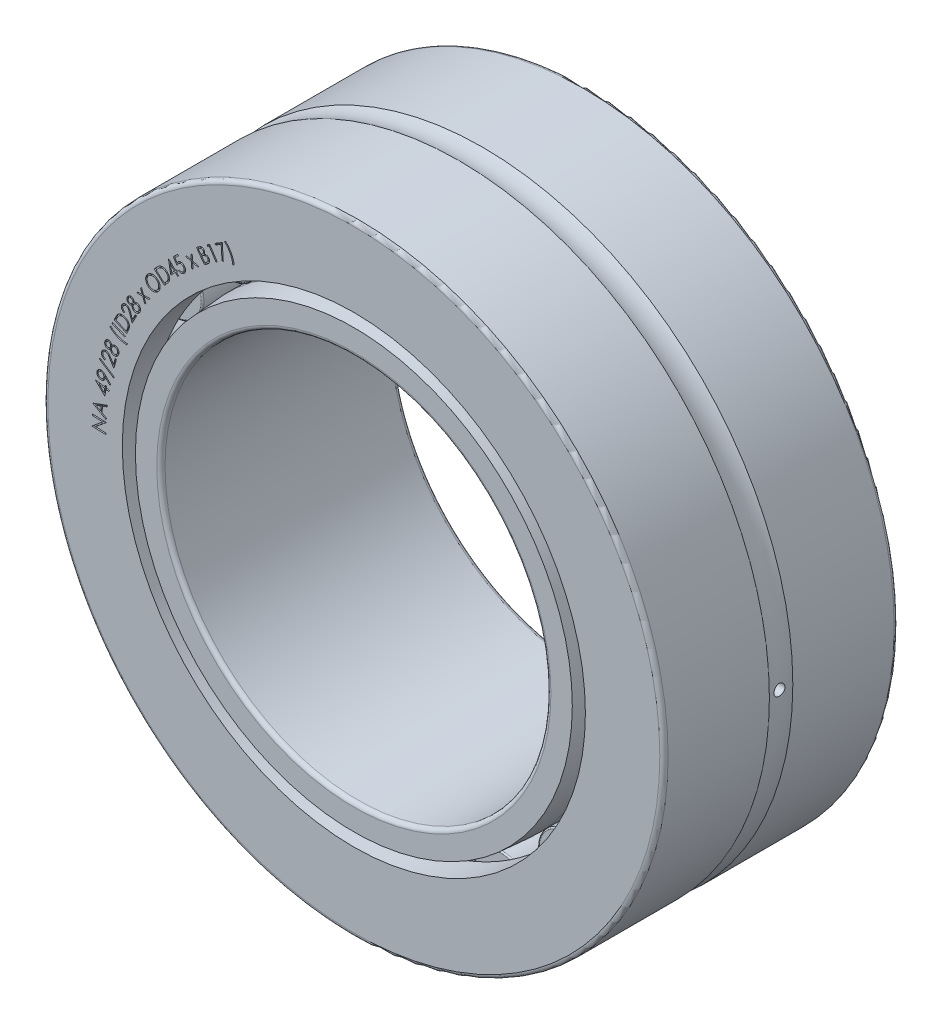
from build123d import *

# Parameters (mm, degrees)
FILLET1_R         = 0.3
EXTRUDE3_REACH    = 53.936
EXTRUDE3_START    = 19
SKETCH3_R         = 0.4
EXTRUDE4_DEPTH    = 0.1
CIRPATTERN1_COUNT = 19


with BuildPart() as part:
    # Sketch2 → Revolve1 (revolve)
    with BuildSketch(Plane(origin=(0, 0, 0), x_dir=(0, 0, -1), z_dir=(1, 0, 0))):
        with BuildLine():
            Line((-8.2, 22.5), (-0.85, 22.5))
            ThreePointArc((-0.85, 22.5), (0, 22.351063589), (0.85, 22.5))
            Line((0.85, 22.5), (8.2, 22.5))
            ThreePointArc((8.2, 22.5), (8.412132034, 22.412132034), (8.5, 22.2))
            Line((8.5, 22.2), (8.5, 16.8))
            Line((8.5, 16.8), (6.4, 16.8))
            Line((6.4, 16.8), (6.4, 20))
            Line((6.4, 20), (-6.4, 20))
            Line((-6.4, 20), (-6.4, 16.8))
            Line((-6.4, 16.8), (-8.5, 16.8))
            Line((-8.5, 16.8), (-8.5, 22.2))
            ThreePointArc((-8.5, 22.2), (-8.412132034, 22.412132034), (-8.2, 22.5))
        make_face()
        Polygon((8.5, 15.85), (8.5, 14), (-8.5, 14), (-8.5, 15.85), (-6.4, 16), (6.4, 16), align=None)
    revolve(axis=Axis((0, 0, 0), (0, 0, -1)))

    # Fillet1
    fillet1_edges = [part.edges().sort_by_distance(p)[0] for p in [
        (0, -14, 8.5),
        (0, -14, -8.5),
    ]]
    fillet(fillet1_edges, radius=FILLET1_R)

    # Sketch3 → Extrude3 (cut, up to next)
    with BuildSketch(Plane(origin=(0, 0, 0), x_dir=(0, 0, -1), z_dir=(1, 0, 0)).offset(EXTRUDE3_START), mode=Mode.PRIVATE) as extrude3_sk1:
        Circle(SKETCH3_R)
    extrude3_tool1 = extrude(extrude3_sk1.sketch, amount=EXTRUDE3_REACH, mode=Mode.PRIVATE) & part.part
    add(extrude3_tool1.solids().sort_by_distance((19, 0, 0))[0], mode=Mode.SUBTRACT)

    # Sketch4 → Extrude4 (cut)
    # profile 1 of 22: a face of its own
    with BuildSketch(Plane(origin=(0, 0, 8.5), x_dir=(-1, 0, 0), z_dir=(0, 0, -1))):
        Polygon((17.996472889, 0.121791409), (18.991026571, 0.150759015), (18.990396098, 0.172392791), (18.209804836, 0.81132278), (18.971198292, 0.833428616), (18.96821559, 0.931574894), (17.973661908, 0.902607288), (17.974337954, 0.880173528), (18.745198989, 0.246507951), (17.99342814, 0.224548994), align=None)
    # profile 2 of 22: a face of its own
    with BuildSketch(Plane(origin=(0, 0, 8.5), x_dir=(-1, 0, 0), z_dir=(0, 0, -1))):
        Polygon((18.920341347, 1.637121483), (17.885993101, 2.015642624), (17.895066614, 1.908859696), (18.23573355, 1.780620634), (18.272497486, 1.351943753), (17.958573518, 1.16849269), (17.967967487, 1.057496164), (18.92232525, 1.612663572), align=None)
        Polygon((18.710303109, 1.606776447), (18.364605561, 1.404833197), (18.335592294, 1.744997426), align=None, mode=Mode.SUBTRACT)
    # profile 3 of 22: a face of its own
    with BuildSketch(Plane(origin=(0, 0, 8.5), x_dir=(-1, 0, 0), z_dir=(0, 0, -1))):
        Polygon((18.753998333, 3.16954266), (18.750876203, 3.189587815), (18.064257066, 3.08157855), (18.0454517, 3.200773164), (17.951061238, 3.185999324), (17.969866604, 3.06680471), (17.740675929, 3.030698765), (17.75611231, 2.932311615), (17.985302985, 2.96841756), (18.059497062, 2.4974127), align=None)
        Polygon((18.079693447, 2.9831914), (18.490433979, 3.047766796), (18.125412636, 2.693102951), align=None, mode=Mode.SUBTRACT)
    # profile 4 of 22: a face of its own
    with BuildSketch(Plane(origin=(0, 0, 8.5), x_dir=(-1, 0, 0), z_dir=(0, 0, -1))):
        with BuildLine():
            Line((17.638190882, 3.442224406), (17.706461692, 3.372514023))
            Line((17.706461692, 3.372514023), (18.05250626, 3.716724534))
            add(Edge.make_bspline(
                [(18.05250626, 3.716724534), (18.051604056, 3.707504632), (18.049844896, 3.689527229), (18.049806866, 3.663045273), (18.051220957, 3.637794911), (18.054089702, 3.621579693), (18.055493079, 3.613647281)],
                knots=[0, 0, 0, 0, 1.0732581, 2.092689843, 3.066952384, 4, 4, 4, 4], degree=3))
            add(Edge.make_bspline(
                [(18.055493079, 3.613647281), (18.057655466, 3.60422345), (18.061928593, 3.58560087), (18.071573345, 3.558914906), (18.083334621, 3.533694776), (18.097915348, 3.510378245), (18.114443583, 3.488418751), (18.133697049, 3.468384657), (18.155302537, 3.449947521), (18.178960545, 3.433153874), (18.204239351, 3.41864334), (18.230440504, 3.406616905), (18.257497228, 3.397722424), (18.285163785, 3.391277216), (18.313606935, 3.387684616), (18.342660851, 3.387201218), (18.372441676, 3.389109666), (18.392284952, 3.392595717), (18.402388397, 3.394370683)],
                knots=[0, 0, 0, 0, 1.014105398, 2.003989565, 2.972170537, 3.929790053, 4.885200999, 5.852417369, 6.839816883, 7.862893425, 8.893267069, 9.895212461, 10.883606586, 11.8776757, 12.873127662, 13.886554599, 14.923913584, 16, 16, 16, 16], degree=3))
            add(Edge.make_bspline(
                [(18.402388397, 3.394370683), (18.415991525, 3.397581773), (18.442741466, 3.403896237), (18.480459721, 3.419619962), (18.515265278, 3.439385769), (18.546739679, 3.463674125), (18.574858225, 3.491615086), (18.598334463, 3.523707571), (18.618073896, 3.558833005), (18.632614804, 3.597172786), (18.642945784, 3.637155311), (18.648054702, 3.67796839), (18.647861717, 3.7191685), (18.643307152, 3.746205423), (18.641009067, 3.759847371)],
                knots=[0, 0, 0, 0, 1.033200542, 2.031742362, 3.012719821, 3.988653018, 4.9662497, 5.936911072, 6.922770683, 7.940039407, 8.963259398, 9.973054839, 10.977269649, 12, 12, 12, 12], degree=3))
            add(Edge.make_bspline(
                [(18.641009067, 3.759847371), (18.637868619, 3.77304596), (18.631664027, 3.799122457), (18.616371579, 3.836173318), (18.596303616, 3.870489061), (18.572224401, 3.902207741), (18.544102854, 3.930238012), (18.512725031, 3.954371088), (18.477864338, 3.973437511), (18.440481066, 3.988037569), (18.401553127, 3.997757973), (18.361977519, 4.002733356), (18.322125669, 4.002209993), (18.295912107, 3.997975763), (18.282723279, 3.995845395)],
                knots=[0, 0, 0, 0, 1.021370084, 2.017924327, 3.007361784, 4.010767802, 5.010785463, 5.991480318, 6.98422743, 7.995015278, 9.008630861, 10.00056117, 10.994022434, 12, 12, 12, 12], degree=3))
            add(Edge.make_bspline(
                [(18.282723279, 3.995845395), (18.272594029, 3.99346522), (18.25197492, 3.988620134), (18.22155637, 3.977497782), (18.190931783, 3.963557823), (18.159886924, 3.945952806), (18.127542917, 3.924133817), (18.093561815, 3.896832841), (18.05688307, 3.864452995), (18.032454842, 3.840192343), (18.019580459, 3.827406276)],
                knots=[0, 0, 0, 0, 0.786812515, 1.601636007, 2.445886264, 3.330919397, 4.299130596, 5.395146614, 6.627166819, 8, 8, 8, 8], degree=3))
            Line((18.019580459, 3.827406276), (17.638190882, 3.442224406))
        make_face()
        with BuildLine():
            add(Edge.make_bspline(
                [(18.136284506, 3.653545975), (18.13505856, 3.660602558), (18.132646355, 3.674487287), (18.131313874, 3.695353298), (18.13204699, 3.715798387), (18.135079267, 3.735824533), (18.139751851, 3.755461832), (18.146716789, 3.774617861), (18.155554772, 3.793409711), (18.166514532, 3.811499248), (18.178827554, 3.82866142), (18.192793674, 3.844110379), (18.207660702, 3.85807465), (18.223887896, 3.870129371), (18.241164337, 3.880455925), (18.25957995, 3.889132908), (18.279254681, 3.895820942), (18.292873258, 3.899025438), (18.299779247, 3.90065044)],
                knots=[0, 0, 0, 0, 1.04197531, 2.050219563, 3.037299054, 4.014132017, 4.993910382, 5.970743345, 6.975702642, 8.011904436, 9.045413072, 10.045424702, 11.038610881, 12.009866746, 12.981706064, 13.96418063, 14.967634651, 16, 16, 16, 16], degree=3))
            add(Edge.make_bspline(
                [(18.299779247, 3.90065044), (18.306774743, 3.901858408), (18.320538896, 3.904235173), (18.341252049, 3.905380485), (18.361611108, 3.904971515), (18.381569706, 3.901921293), (18.40109802, 3.897067616), (18.420203367, 3.890243075), (18.438841975, 3.881179745), (18.456915906, 3.870300838), (18.474152011, 3.857969606), (18.48947515, 3.843874709), (18.503611423, 3.829083594), (18.515568437, 3.81277364), (18.525991193, 3.79540723), (18.534679894, 3.776919755), (18.541407371, 3.757120554), (18.544649294, 3.743443003), (18.546300782, 3.736475435)],
                knots=[0, 0, 0, 0, 1.033097565, 2.0326954, 3.01622156, 3.993574093, 4.966076212, 5.943428745, 6.942458734, 7.979211676, 9.013270027, 10.022612918, 11.007196272, 11.988411874, 12.960768106, 13.953482721, 14.957470471, 16, 16, 16, 16], degree=3))
            add(Edge.make_bspline(
                [(18.546300782, 3.736475435), (18.547508749, 3.729479939), (18.549885514, 3.715715788), (18.551030836, 3.695002624), (18.550621826, 3.674643604), (18.547571753, 3.654684866), (18.54271752, 3.635157073), (18.535895078, 3.616049757), (18.526823635, 3.597418759), (18.515976229, 3.579315281), (18.503546394, 3.562214694), (18.48991395, 3.546532972), (18.474818756, 3.532875712), (18.458898886, 3.52054735), (18.441548551, 3.510275708), (18.423126053, 3.501660569), (18.403562401, 3.494658989), (18.389933201, 3.491498754), (18.383019746, 3.489895714)],
                knots=[0, 0, 0, 0, 1.035357754, 2.037142488, 3.022820386, 4.002311151, 4.97694089, 5.956431655, 6.957647301, 7.996668428, 9.032989072, 10.039928294, 11.023338877, 11.99962408, 12.974107613, 13.95925533, 14.964825755, 16, 16, 16, 16], degree=3))
            add(Edge.make_bspline(
                [(18.383019746, 3.489895714), (18.37602441, 3.488693484), (18.362260571, 3.486328009), (18.341517124, 3.485098904), (18.321138458, 3.485817306), (18.301157285, 3.488808238), (18.281555537, 3.493617447), (18.26248173, 3.500768697), (18.243627094, 3.50957178), (18.225545165, 3.520548065), (18.208375079, 3.532851265), (18.192995863, 3.54679719), (18.178986492, 3.561536903), (18.167000043, 3.577738864), (18.156644921, 3.595001473), (18.148054722, 3.613443967), (18.141046382, 3.633002199), (18.137887075, 3.646632143), (18.136284506, 3.653545975)],
                knots=[0, 0, 0, 0, 1.034457818, 2.035371798, 3.024276664, 4.002916052, 4.97669864, 5.961952979, 6.968770714, 8.006888722, 9.042308593, 10.044169512, 11.030049241, 12.003101218, 12.976737727, 13.961029151, 14.965725531, 16, 16, 16, 16], degree=3))
        make_face(mode=Mode.SUBTRACT)
    # profile 5 of 22: a face of its own
    with BuildSketch(Plane(origin=(0, 0, 8.5), x_dir=(-1, 0, 0), z_dir=(0, 0, -1))):
        Polygon((18.421989296, 4.728812776), (17.396447208, 4.055828798), (17.420675372, 3.955216871), (18.446492151, 4.62766634), align=None)
    # profile 6 of 22: a face of its own
    with BuildSketch(Plane(origin=(0, 0, 8.5), x_dir=(-1, 0, 0), z_dir=(0, 0, -1))):
        with BuildLine():
            Line((18.036322033, 4.86443921), (18.062160313, 4.772634929))
            add(Edge.make_bspline(
                [(18.062160313, 4.772634929), (18.073538521, 4.776493793), (18.09594989, 4.784094499), (18.127768179, 4.798528297), (18.157292666, 4.815155906), (18.184382553, 4.834135681), (18.209098969, 4.855449637), (18.23144562, 4.879094619), (18.251332687, 4.905082028), (18.26883688, 4.932933226), (18.283705424, 4.96207284), (18.295283319, 4.99215604), (18.303647642, 5.022803631), (18.308769917, 5.053989569), (18.310603345, 5.085710822), (18.309144375, 5.117927364), (18.304705699, 5.150724729), (18.299116142, 5.172352445), (18.296282024, 5.183318516)],
                knots=[0, 0, 0, 0, 1.094490885, 2.155790977, 3.178835772, 4.178739715, 5.165219517, 6.148389985, 7.138467356, 8.142750825, 9.142654768, 10.115182541, 11.075273312, 12.033066126, 12.990298098, 13.965601866, 14.968483013, 16, 16, 16, 16], degree=3))
            add(Edge.make_bspline(
                [(18.296282024, 5.183318516), (18.293007655, 5.194028018), (18.286613948, 5.214939957), (18.273743136, 5.24454529), (18.258921266, 5.271873759), (18.241882923, 5.297027072), (18.222539082, 5.319778101), (18.200774168, 5.340015353), (18.176969148, 5.358074456), (18.151083307, 5.373408079), (18.1240364, 5.386203476), (18.096521195, 5.396459609), (18.06878354, 5.404081337), (18.040669565, 5.408538995), (18.01238486, 5.41020719), (17.983878583, 5.40903677), (17.955105159, 5.405166559), (17.93614178, 5.400352401), (17.9265161, 5.397908767)],
                knots=[0, 0, 0, 0, 1.124955002, 2.196646424, 3.238408797, 4.246321514, 5.24500639, 6.233420632, 7.228082455, 8.242833239, 9.251885131, 10.232060537, 11.191211904, 12.138381238, 13.088020749, 14.034642923, 15.002398395, 16, 16, 16, 16], degree=3))
            add(Edge.make_bspline(
                [(17.9265161, 5.397908767), (17.913304586, 5.393639138), (17.887061612, 5.385158068), (17.849968792, 5.366740525), (17.815574962, 5.343661401), (17.789027758, 5.320567316), (17.768386703, 5.299057726), (17.752103311, 5.27999465), (17.734571072, 5.258407465), (17.71635196, 5.233938766), (17.696975597, 5.206809638), (17.677031245, 5.176745496), (17.655700718, 5.144259657), (17.641657702, 5.121409278), (17.634386741, 5.109578187)],
                knots=[0, 0, 0, 0, 1.185391686, 2.354628118, 3.525423347, 4.716939784, 5.353656762, 6.071995119, 6.858961581, 7.730074794, 8.678752111, 9.707901892, 10.813235379, 12, 12, 12, 12], degree=3))
            Line((17.634386741, 5.109578187), (17.444603527, 4.798547681))
            Line((17.444603527, 4.798547681), (17.319848649, 5.240780955))
            Line((17.319848649, 5.240780955), (17.227256779, 5.214693908))
            Line((17.227256779, 5.214693908), (17.410887955, 4.564122232))
            Line((17.410887955, 4.564122232), (17.702919965, 5.04165347))
            add(Edge.make_bspline(
                [(17.702919965, 5.04165347), (17.710037987, 5.053262344), (17.723696485, 5.075538164), (17.743714121, 5.107435906), (17.762382336, 5.136352828), (17.780226447, 5.162104337), (17.796434632, 5.185071319), (17.811595972, 5.204976552), (17.825283194, 5.222019536), (17.841994517, 5.240394569), (17.863012313, 5.259903173), (17.89045357, 5.278675579), (17.919561988, 5.294102539), (17.940313812, 5.300802056), (17.950725649, 5.304163413)],
                knots=[0, 0, 0, 0, 1.324220742, 2.540995906, 3.662167083, 4.670913546, 5.587504429, 6.395438409, 7.103940389, 7.712249996, 8.810010195, 9.883024252, 10.937847289, 12, 12, 12, 12], degree=3))
            add(Edge.make_bspline(
                [(17.950725649, 5.304163413), (17.957425968, 5.305858461), (17.970593527, 5.309189592), (17.990670161, 5.311609666), (18.010500326, 5.312420674), (18.030256544, 5.310749342), (18.049719327, 5.306854412), (18.069115056, 5.301353587), (18.088151373, 5.293224149), (18.106983453, 5.283513081), (18.124824673, 5.271820374), (18.141410728, 5.258828277), (18.156333349, 5.244437573), (18.169830755, 5.228808286), (18.181480606, 5.211604961), (18.191617525, 5.193130483), (18.20035536, 5.17333861), (18.204579881, 5.159386578), (18.206731158, 5.152281701)],
                knots=[0, 0, 0, 0, 1.001254379, 1.967678841, 2.92606647, 3.875016469, 4.834430707, 5.801000674, 6.792658145, 7.830510942, 8.869988487, 9.880887783, 10.881345937, 11.87148957, 12.869977854, 13.887809112, 14.924396455, 16, 16, 16, 16], degree=3))
            add(Edge.make_bspline(
                [(18.206731158, 5.152281701), (18.208630968, 5.144700674), (18.212349406, 5.129862571), (18.215724209, 5.1074521), (18.216672444, 5.085441122), (18.215785529, 5.063783572), (18.212003609, 5.042686662), (18.206576948, 5.021936577), (18.198764754, 5.001642545), (18.188798618, 4.981936826), (18.176846583, 4.963006624), (18.16280525, 4.945126614), (18.146540437, 4.928681616), (18.128458437, 4.913304986), (18.108400795, 4.899079451), (18.086157752, 4.886281546), (18.062057342, 4.874460642), (18.045030559, 4.867830345), (18.036322033, 4.86443921)],
                knots=[0, 0, 0, 0, 1.007134221, 1.971231733, 2.915136482, 3.843887765, 4.758895679, 5.672201554, 6.605330197, 7.556078468, 8.514626727, 9.48683633, 10.480565689, 11.491005009, 12.543396126, 13.645480509, 14.795756455, 16, 16, 16, 16], degree=3))
        make_face()
    # profile 7 of 22: a face of its own
    with BuildSketch(Plane(origin=(0, 0, 8.5), x_dir=(-1, 0, 0), z_dir=(0, 0, -1))):
        with BuildLine():
            add(Edge.make_bspline(
                [(17.565584472, 5.944083703), (17.559002314, 5.950526367), (17.54622419, 5.963033688), (17.526674718, 5.980489507), (17.507058189, 5.995771348), (17.487737703, 6.009630114), (17.468383916, 6.021322615), (17.449229994, 6.031325954), (17.430273574, 6.039541778), (17.4052698, 6.047810875), (17.373708014, 6.054412025), (17.335199363, 6.056193008), (17.29624545, 6.052189868), (17.270918655, 6.045014542), (17.258050286, 6.041368809)],
                knots=[0, 0, 0, 0, 0.969090864, 1.88132263, 2.755730094, 3.584459137, 4.381643771, 5.132627056, 5.856840589, 6.552724299, 7.901130413, 9.234368454, 10.594801781, 12, 12, 12, 12], degree=3))
            add(Edge.make_bspline(
                [(17.258050286, 6.041368809), (17.249079939, 6.038189738), (17.231389884, 6.031920423), (17.206234777, 6.0197647), (17.182747449, 6.005627351), (17.160728219, 5.989628407), (17.140224941, 5.971695641), (17.121160616, 5.951897949), (17.103681879, 5.930029888), (17.093608573, 5.914152959), (17.088501651, 5.90610374)],
                knots=[0, 0, 0, 0, 1.030001312, 2.031223498, 3.019118417, 3.995326586, 4.97474316, 5.964990558, 6.968299496, 8, 8, 8, 8], degree=3))
            add(Edge.make_bspline(
                [(17.088501651, 5.90610374), (17.082772335, 5.895879952), (17.071386385, 5.875562076), (17.058981483, 5.842914981), (17.050642729, 5.809020816), (17.046019829, 5.77389216), (17.045803836, 5.737412513), (17.049177594, 5.699695403), (17.056737575, 5.660673498), (17.064643775, 5.634765151), (17.068703754, 5.621460739)],
                knots=[0, 0, 0, 0, 0.953075158, 1.894059418, 2.832276164, 3.789574067, 4.771315737, 5.795887214, 6.868147578, 8, 8, 8, 8], degree=3))
            add(Edge.make_bspline(
                [(17.068703754, 5.621460739), (17.073124785, 5.608781943), (17.081696329, 5.58420015), (17.098042315, 5.549775642), (17.115977484, 5.518464908), (17.136067102, 5.490476224), (17.158246751, 5.465839775), (17.182449464, 5.444483017), (17.208813401, 5.42649), (17.236933601, 5.412069035), (17.265937321, 5.401008523), (17.294724462, 5.391822591), (17.323387724, 5.385902043), (17.351773974, 5.382419741), (17.379945261, 5.381759006), (17.407824153, 5.383958627), (17.435492582, 5.388586688), (17.453377516, 5.394046879), (17.462400404, 5.396801526)],
                knots=[0, 0, 0, 0, 1.268728168, 2.459824634, 3.59694295, 4.676596336, 5.710615061, 6.724784385, 7.721111182, 8.720613325, 9.705027397, 10.653330858, 11.574514822, 12.467756298, 13.35425674, 14.233601953, 15.108858221, 16, 16, 16, 16], degree=3))
            add(Edge.make_bspline(
                [(17.462400404, 5.396801526), (17.475126173, 5.401570872), (17.500256505, 5.410989182), (17.534786091, 5.431316012), (17.565305258, 5.456549522), (17.587711721, 5.481069103), (17.603347019, 5.503270337), (17.614303801, 5.521617871), (17.624181046, 5.54163535), (17.63277057, 5.56336713), (17.640622916, 5.586609741), (17.647233716, 5.611552906), (17.653210234, 5.638036469), (17.65601554, 5.656359127), (17.657452433, 5.665744094)],
                knots=[0, 0, 0, 0, 1.386599848, 2.738201263, 4.070291771, 5.420290977, 6.11713152, 6.841867111, 7.601624042, 8.394945631, 9.227709629, 10.106723913, 11.030253469, 12, 12, 12, 12], degree=3))
            add(Edge.make_bspline(
                [(17.657452433, 5.665744094), (17.667219658, 5.656770923), (17.686167569, 5.639363438), (17.716867962, 5.617646078), (17.748543894, 5.601235318), (17.780842394, 5.590043156), (17.813268548, 5.583724726), (17.845386147, 5.582011449), (17.877130712, 5.585060953), (17.897425372, 5.590891829), (17.907632162, 5.59382435)],
                knots=[0, 0, 0, 0, 1.159025018, 2.248448447, 3.27732084, 4.268521419, 5.227305361, 6.156618964, 7.072908694, 8, 8, 8, 8], degree=3))
            add(Edge.make_bspline(
                [(17.907632162, 5.59382435), (17.917762574, 5.597640777), (17.938205821, 5.605342355), (17.966372957, 5.622935033), (17.992968704, 5.644445947), (18.016780425, 5.670567132), (18.038269219, 5.699709583), (18.055087349, 5.73220747), (18.067881721, 5.767005235), (18.07595489, 5.803922951), (18.079915412, 5.842003544), (18.078981685, 5.880510656), (18.073538193, 5.919014829), (18.066190205, 5.943991513), (18.062480075, 5.956602685)],
                knots=[0, 0, 0, 0, 0.890399138, 1.79683216, 2.722561421, 3.702747162, 4.70191153, 5.698890471, 6.707950785, 7.749730673, 8.805663473, 9.856289648, 10.917602449, 12, 12, 12, 12], degree=3))
            add(Edge.make_bspline(
                [(18.062480075, 5.956602685), (18.058082689, 5.96861974), (18.049395857, 5.992358874), (18.03096371, 6.025369346), (18.009120782, 6.055815248), (17.983497434, 6.082991218), (17.955106808, 6.106549576), (17.92471474, 6.126331759), (17.891949175, 6.141124609), (17.857820377, 6.151451549), (17.823090924, 6.157512578), (17.788716267, 6.158627446), (17.754926042, 6.155184926), (17.73335104, 6.149063956), (17.722502141, 6.145986052)],
                knots=[0, 0, 0, 0, 1.065969249, 2.105772862, 3.141840194, 4.185069367, 5.211766728, 6.213116047, 7.200440589, 8.199696411, 9.180589829, 10.132249918, 11.060809619, 12, 12, 12, 12], degree=3))
            add(Edge.make_bspline(
                [(17.722502141, 6.145986052), (17.712144349, 6.142144416), (17.691821186, 6.13460669), (17.664020227, 6.118158338), (17.639338862, 6.098261459), (17.61797814, 6.074561356), (17.599833687, 6.047219192), (17.585200718, 6.016101924), (17.573278258, 5.981473527), (17.568211412, 5.956849958), (17.565584472, 5.944083703)],
                knots=[0, 0, 0, 0, 0.9809554, 1.924745915, 2.858107693, 3.791072582, 4.751093097, 5.765980779, 6.841757729, 8, 8, 8, 8], degree=3))
        make_face()
        with BuildLine():
            add(Edge.make_bspline(
                [(17.971845486, 5.921504309), (17.973819172, 5.915098688), (17.977685323, 5.902551042), (17.981302313, 5.883524989), (17.983727447, 5.864885281), (17.984021471, 5.84653631), (17.982870171, 5.828541575), (17.979721044, 5.81097555), (17.975057966, 5.793712221), (17.968435798, 5.777065649), (17.960822446, 5.761226481), (17.951763081, 5.746757301), (17.941835173, 5.733601321), (17.930708366, 5.721866033), (17.918509536, 5.711572056), (17.905146805, 5.702760797), (17.890771008, 5.695251845), (17.880500921, 5.691602966), (17.875335747, 5.689767821)],
                knots=[0, 0, 0, 0, 1.150499767, 2.253655501, 3.322097028, 4.375471426, 5.400615696, 6.414727918, 7.435821616, 8.46685242, 9.487752833, 10.450487165, 11.394244402, 12.314498404, 13.22244678, 14.129742867, 15.059384557, 16, 16, 16, 16], degree=3))
            add(Edge.make_bspline(
                [(17.875335747, 5.689767821), (17.870041191, 5.688188011), (17.85953058, 5.685051816), (17.843303117, 5.682753766), (17.826979585, 5.681869079), (17.810447599, 5.683333908), (17.793658506, 5.686457495), (17.776588732, 5.691234967), (17.759494421, 5.698303576), (17.742389573, 5.706751863), (17.72589922, 5.716718664), (17.710595545, 5.72790811), (17.69668733, 5.740226858), (17.68423725, 5.75372041), (17.673158688, 5.768317502), (17.663677205, 5.784044244), (17.655166172, 5.800689538), (17.650996039, 5.812544333), (17.6488754, 5.818572858)],
                knots=[0, 0, 0, 0, 0.922086652, 1.830501928, 2.731071058, 3.648487516, 4.595815939, 5.582289509, 6.60422243, 7.682127573, 8.767916071, 9.819629584, 10.845999766, 11.867506183, 12.882961439, 13.90227159, 14.933241095, 16, 16, 16, 16], degree=3))
            add(Edge.make_bspline(
                [(17.6488754, 5.818572858), (17.646662834, 5.82642195), (17.642250225, 5.842075714), (17.63918683, 5.866297491), (17.63932708, 5.890779632), (17.642195952, 5.915264166), (17.648331346, 5.93916257), (17.657562314, 5.961702362), (17.669269816, 5.982930543), (17.684223294, 6.001901618), (17.700926145, 6.018691853), (17.718778662, 6.032996157), (17.737644311, 6.04446994), (17.751162441, 6.049532317), (17.757817426, 6.052024529)],
                knots=[0, 0, 0, 0, 1.029832345, 2.053836581, 3.073517751, 4.118460147, 5.162549877, 6.181706852, 7.190463994, 8.216588217, 9.22414391, 10.178570378, 11.103308836, 12, 12, 12, 12], degree=3))
            add(Edge.make_bspline(
                [(17.757817426, 6.052024529), (17.762621003, 6.053461457), (17.772177973, 6.0563203), (17.786973578, 6.058667238), (17.801928171, 6.059345861), (17.817053361, 6.058947644), (17.832334988, 6.05649898), (17.847847264, 6.052800313), (17.863481765, 6.047330817), (17.879242202, 6.040662361), (17.894492865, 6.032077996), (17.908968196, 6.021754397), (17.922184757, 6.009421039), (17.934597179, 5.995559942), (17.945456616, 5.979469005), (17.955581584, 5.961851104), (17.964412372, 5.942325659), (17.969322426, 5.928571808), (17.971845486, 5.921504309)],
                knots=[0, 0, 0, 0, 0.858974057, 1.708974256, 2.559976224, 3.423591978, 4.29791755, 5.208232486, 6.154622466, 7.134491961, 8.138869408, 9.149037698, 10.175169876, 11.232445011, 12.332077621, 13.496551284, 14.7135879, 16, 16, 16, 16], degree=3))
        make_face(mode=Mode.SUBTRACT)
        with BuildLine():
            add(Edge.make_bspline(
                [(17.562906035, 5.7916549), (17.565387557, 5.783613799), (17.570275054, 5.767776404), (17.574726575, 5.743632414), (17.577091459, 5.719853927), (17.577277626, 5.696381206), (17.574727277, 5.673278239), (17.570027307, 5.650530846), (17.563067353, 5.628053431), (17.553767114, 5.606290926), (17.542852278, 5.58547402), (17.5303698, 5.566334432), (17.516742407, 5.548848718), (17.501601415, 5.533385917), (17.485053861, 5.519938504), (17.467200728, 5.508319017), (17.448160693, 5.49827171), (17.434544968, 5.493408469), (17.427687479, 5.490959123)],
                knots=[0, 0, 0, 0, 1.102714468, 2.171857324, 3.212509769, 4.233526903, 5.243673008, 6.254426126, 7.275443259, 8.323620139, 9.353608819, 10.353839326, 11.316096183, 12.256105045, 13.185285274, 14.106177225, 15.046186087, 16, 16, 16, 16], degree=3))
            add(Edge.make_bspline(
                [(17.427687479, 5.490959123), (17.418955816, 5.488420591), (17.401586805, 5.483370947), (17.374393284, 5.480715652), (17.346885525, 5.481659173), (17.319293992, 5.486467428), (17.29230293, 5.49460027), (17.266851258, 5.506961789), (17.243071714, 5.522800349), (17.221187215, 5.542347492), (17.201597609, 5.56537758), (17.184102923, 5.591339425), (17.169387394, 5.620555564), (17.161746233, 5.641470328), (17.157825187, 5.652202699)],
                knots=[0, 0, 0, 0, 0.929880202, 1.849716376, 2.784540582, 3.742506523, 4.711208352, 5.662900838, 6.630176487, 7.629716169, 8.658601965, 9.720017403, 10.830031398, 12, 12, 12, 12], degree=3))
            add(Edge.make_bspline(
                [(17.157825187, 5.652202699), (17.155159724, 5.660695813), (17.149969934, 5.677232338), (17.145260124, 5.702319895), (17.142278724, 5.726554056), (17.141954483, 5.750225236), (17.143848696, 5.773130728), (17.148477445, 5.795372626), (17.155000069, 5.817009313), (17.164264725, 5.837626428), (17.175092529, 5.857048317), (17.187449584, 5.874904271), (17.200889185, 5.891193738), (17.21572958, 5.905691272), (17.231928149, 5.918336609), (17.249255479, 5.929453931), (17.267925917, 5.938754268), (17.281066806, 5.943544544), (17.287706212, 5.94596482)],
                knots=[0, 0, 0, 0, 1.189034051, 2.315109861, 3.406870647, 4.44980185, 5.474347007, 6.472974043, 7.481763867, 8.489368042, 9.488234451, 10.450902216, 11.388406611, 12.307496898, 13.218444042, 14.131139143, 15.055762003, 16, 16, 16, 16], degree=3))
            add(Edge.make_bspline(
                [(17.287706212, 5.94596482), (17.294294223, 5.947927763), (17.307354395, 5.951819131), (17.32745165, 5.955160157), (17.347688544, 5.955908968), (17.367957855, 5.954785516), (17.38836737, 5.951362654), (17.408934658, 5.945913426), (17.42946771, 5.937773536), (17.449955696, 5.927905505), (17.469695565, 5.916185109), (17.488115174, 5.902896264), (17.504648787, 5.887864091), (17.519746353, 5.871601111), (17.533171714, 5.853731245), (17.544893342, 5.834456867), (17.554996419, 5.81371528), (17.560236015, 5.799101742), (17.562906035, 5.7916549)],
                knots=[0, 0, 0, 0, 0.944062993, 1.871524693, 2.790275499, 3.721949148, 4.656375162, 5.629425421, 6.640040893, 7.686673331, 8.751806267, 9.790768007, 10.802133039, 11.817486382, 12.836068728, 13.867874103, 14.913500454, 16, 16, 16, 16], degree=3))
        make_face(mode=Mode.SUBTRACT)
    # profile 8 of 22: a face of its own
    with BuildSketch(Plane(origin=(0, 0, 8.5), x_dir=(-1, 0, 0), z_dir=(0, 0, -1))):
        with BuildLine():
            Line((17.686197867, 7.028498882), (17.646399356, 7.129965636))
            add(Edge.make_bspline(
                [(17.646399356, 7.129965636), (17.637735242, 7.120661491), (17.620193777, 7.101824212), (17.592276335, 7.074531818), (17.562641112, 7.047646704), (17.531759206, 7.020611648), (17.499026834, 6.994001197), (17.464607981, 6.967756455), (17.428664756, 6.941666661), (17.378630218, 6.907069925), (17.313574498, 6.86571595), (17.232084664, 6.82040363), (17.147542093, 6.778861977), (17.089132476, 6.75490659), (17.059731281, 6.742848353)],
                knots=[0, 0, 0, 0, 0.645954272, 1.307806514, 1.983047387, 2.679017541, 3.393128946, 4.126095237, 4.878155559, 5.649747672, 7.216934876, 8.79284314, 10.385638383, 12, 12, 12, 12], degree=3))
            add(Edge.make_bspline(
                [(17.059731281, 6.742848353), (17.032346302, 6.732407252), (16.977995404, 6.711684825), (16.895417647, 6.685373091), (16.812949269, 6.663009373), (16.731199618, 6.644727535), (16.651335013, 6.630722586), (16.574482011, 6.62096597), (16.501129226, 6.615606583), (16.453411624, 6.615618765), (16.430197008, 6.615624692)],
                knots=[0, 0, 0, 0, 1.088427606, 2.160199542, 3.217505076, 4.261367009, 5.270553571, 6.228069258, 7.137955576, 8, 8, 8, 8], degree=3))
            Line((16.430197008, 6.615624692), (16.46819311, 6.519323888))
            add(Edge.make_bspline(
                [(16.46819311, 6.519323888), (16.490463752, 6.519367747), (16.536433453, 6.519458278), (16.60742696, 6.524719641), (16.682305292, 6.534488905), (16.760625115, 6.548027262), (16.840991098, 6.565938431), (16.922248376, 6.587881548), (17.003692369, 6.614095048), (17.057471139, 6.634459242), (17.08462409, 6.644741142)],
                knots=[0, 0, 0, 0, 0.844462767, 1.74308859, 2.69754615, 3.707648071, 4.756590134, 5.819224983, 6.898924678, 8, 8, 8, 8], degree=3))
            add(Edge.make_bspline(
                [(17.08462409, 6.644741142), (17.113621343, 6.65656316), (17.171332597, 6.680091714), (17.255196856, 6.720460943), (17.336373784, 6.764260329), (17.414508944, 6.811423237), (17.489217603, 6.861444202), (17.559456164, 6.914371928), (17.62537101, 6.969613567), (17.666042304, 7.008986668), (17.686197867, 7.028498882)],
                knots=[0, 0, 0, 0, 1.045896179, 2.081575795, 3.107385835, 4.126294506, 5.12928575, 6.109465071, 7.063103456, 8, 8, 8, 8], degree=3))
        make_face()
    # profile 9 of 22: a face of its own
    with BuildSketch(Plane(origin=(0, 0, 8.5), x_dir=(-1, 0, 0), z_dir=(0, 0, -1))):
        Polygon((17.532144141, 7.318582106), (17.493507645, 7.410539882), (16.572662487, 7.023453465), (16.611298983, 6.931495689), align=None)
    # profile 10 of 22: a face of its own
    with BuildSketch(Plane(origin=(0, 0, 8.5), x_dir=(-1, 0, 0), z_dir=(0, 0, -1))):
        with BuildLine():
            Line((16.482429722, 7.226048), (17.384675083, 7.645545814))
            Line((17.384675083, 7.645545814), (17.297738231, 7.832646219))
            add(Edge.make_bspline(
                [(17.297738231, 7.832646219), (17.290122547, 7.848913953), (17.275413084, 7.880334591), (17.252406031, 7.924876648), (17.230691436, 7.965820291), (17.209088207, 8.002590406), (17.188473946, 8.035645285), (17.168150547, 8.064649074), (17.148639203, 8.089817394), (17.134967615, 8.10451892), (17.128540443, 8.111430277)],
                knots=[0, 0, 0, 0, 1.316512192, 2.542803607, 3.674399801, 4.713175152, 5.66827546, 6.529016435, 7.30847359, 8, 8, 8, 8], degree=3))
            add(Edge.make_bspline(
                [(17.128540443, 8.111430277), (17.119550457, 8.120230251), (17.101727885, 8.137676125), (17.072977482, 8.161064988), (17.042972258, 8.181730702), (17.011563525, 8.199418935), (16.979039579, 8.214678855), (16.945098583, 8.226902992), (16.909918123, 8.23633304), (16.873587388, 8.242820088), (16.836541704, 8.246695324), (16.799054739, 8.247466247), (16.761315564, 8.245373578), (16.72321937, 8.240514213), (16.684948398, 8.232258697), (16.646297234, 8.22143873), (16.607336138, 8.207694875), (16.58180694, 8.19629455), (16.568851103, 8.190508988)],
                knots=[0, 0, 0, 0, 0.996863991, 1.976274477, 2.933841362, 3.881717408, 4.830671821, 5.778592209, 6.737635681, 7.714611351, 8.701247638, 9.687500454, 10.683591164, 11.695201371, 12.728651647, 13.784273231, 14.875538646, 16, 16, 16, 16], degree=3))
            add(Edge.make_bspline(
                [(16.568851103, 8.190508988), (16.557775617, 8.185167419), (16.535947161, 8.174639827), (16.504888019, 8.156638497), (16.475589634, 8.1375391), (16.448028691, 8.117150631), (16.422486507, 8.095254601), (16.398866136, 8.0719156), (16.377057679, 8.047324063), (16.357098925, 8.02151741), (16.339277084, 7.994868383), (16.323745251, 7.967641773), (16.310240355, 7.940225706), (16.298921231, 7.912474242), (16.289642935, 7.884471254), (16.282891888, 7.856035159), (16.277931454, 7.827356417), (16.275588649, 7.798089285), (16.275545092, 7.767808996), (16.278207971, 7.736145727), (16.283275287, 7.702834116), (16.291426766, 7.668003091), (16.301877093, 7.631491601), (16.315044772, 7.593341581), (16.330775792, 7.553607132), (16.342853079, 7.526874027), (16.349062753, 7.513128899)],
                knots=[0, 0, 0, 0, 1.090523404, 2.149291026, 3.181951158, 4.192073564, 5.188344125, 6.16389979, 7.135689269, 8.102156017, 9.055940411, 9.977331629, 10.881033935, 11.765246739, 12.634268055, 13.49525698, 14.355756682, 15.213785645, 16.09664808, 17.039125633, 18.029939362, 19.083190802, 20.210267553, 21.397879116, 22.662090099, 24, 24, 24, 24], degree=3))
            Line((16.349062753, 7.513128899), (16.482429722, 7.226048))
        make_face()
        with BuildLine():
            Line((16.527598009, 7.352272773), (16.479091361, 7.456626246))
            add(Edge.make_bspline(
                [(16.479091361, 7.456626246), (16.47217302, 7.471658223), (16.458899739, 7.500498037), (16.440625755, 7.542321105), (16.424984062, 7.580986342), (16.411593847, 7.616390197), (16.400274982, 7.648447334), (16.391912969, 7.677426882), (16.385487746, 7.703048427), (16.382905055, 7.719221558), (16.381708707, 7.726713241)],
                knots=[0, 0, 0, 0, 1.379099995, 2.645891868, 3.80343582, 4.854759208, 5.800572302, 6.63558959, 7.367980726, 8, 8, 8, 8], degree=3))
            add(Edge.make_bspline(
                [(16.381708707, 7.726713241), (16.380724559, 7.736394568), (16.378781877, 7.755505272), (16.378720737, 7.784037168), (16.38093636, 7.811926734), (16.385269852, 7.839233264), (16.391976927, 7.865997486), (16.401260647, 7.892029022), (16.41245152, 7.917659916), (16.426162687, 7.942425947), (16.441898433, 7.96646794), (16.459827045, 7.989223172), (16.479850599, 8.010713942), (16.501840697, 8.030907364), (16.526081442, 8.049708515), (16.5519887, 8.067647921), (16.580323045, 8.083792294), (16.600104736, 8.093520419), (16.610199982, 8.098485001)],
                knots=[0, 0, 0, 0, 0.995141119, 1.964384315, 2.914219769, 3.85504482, 4.789997743, 5.732730786, 6.679613376, 7.648302643, 8.625339526, 9.616533148, 10.608291661, 11.627689712, 12.667419479, 13.744759711, 14.849076929, 16, 16, 16, 16], degree=3))
            add(Edge.make_bspline(
                [(16.610199982, 8.098485001), (16.620973788, 8.103295723), (16.642134676, 8.112744485), (16.674479161, 8.124169902), (16.706522542, 8.132965621), (16.738310281, 8.139488616), (16.76979397, 8.143246557), (16.801048262, 8.144667016), (16.832019745, 8.14347004), (16.862600007, 8.139596902), (16.892546007, 8.133564029), (16.921557473, 8.124908326), (16.949386968, 8.113638247), (16.976278437, 8.100391324), (17.001689939, 8.084160665), (17.026386232, 8.066205882), (17.04968882, 8.045376561), (17.06410056, 8.030062421), (17.071415173, 8.0222898)],
                knots=[0, 0, 0, 0, 1.124041567, 2.207735678, 3.264952718, 4.288525784, 5.297035522, 6.283237389, 7.267137443, 8.246665686, 9.217641471, 10.175159261, 11.12693009, 12.076081039, 13.027256106, 13.996541586, 14.983153925, 16, 16, 16, 16], degree=3))
            add(Edge.make_bspline(
                [(17.071415173, 8.0222898), (17.077042327, 8.015672087), (17.089081643, 8.001513464), (17.106431545, 7.97743402), (17.124614209, 7.949637664), (17.143845432, 7.918252127), (17.163501281, 7.88290543), (17.183922032, 7.843747408), (17.205601137, 7.801002327), (17.21966338, 7.770906661), (17.226962665, 7.755284912)],
                knots=[0, 0, 0, 0, 0.672508427, 1.438834253, 2.296217071, 3.244669164, 4.288704381, 5.427591447, 6.664740547, 8, 8, 8, 8], degree=3))
            Line((17.226962665, 7.755284912), (17.256684828, 7.691417391))
            Line((17.256684828, 7.691417391), (16.527598009, 7.352272773))
        make_face(mode=Mode.SUBTRACT)
    # profile 11 of 22: a face of its own
    with BuildSketch(Plane(origin=(0, 0, 8.5), x_dir=(-1, 0, 0), z_dir=(0, 0, -1))):
        with BuildLine():
            Line((16.633372633, 8.509138868), (16.67798498, 8.424372146))
            add(Edge.make_bspline(
                [(16.67798498, 8.424372146), (16.688418843, 8.430467353), (16.708925022, 8.44244656), (16.737008809, 8.463473474), (16.762629154, 8.485906413), (16.785158265, 8.510358247), (16.805027772, 8.536418572), (16.822179208, 8.564147252), (16.836279452, 8.593825384), (16.847715526, 8.624810942), (16.855943425, 8.656693128), (16.861246143, 8.688652325), (16.86283629, 8.720484099), (16.861868423, 8.752160562), (16.856570159, 8.783610138), (16.848642163, 8.814978732), (16.837383459, 8.846213135), (16.827452038, 8.86628255), (16.822405293, 8.876481013)],
                knots=[0, 0, 0, 0, 1.0961467, 2.15431049, 3.179009889, 4.183702719, 5.166880558, 6.150058396, 7.137673468, 8.144740642, 9.143730414, 10.12258229, 11.080029275, 12.032917832, 12.993372621, 13.968463574, 14.967655617, 16, 16, 16, 16], degree=3))
            add(Edge.make_bspline(
                [(16.822405293, 8.876481013), (16.816931049, 8.886294984), (16.806214976, 8.905506265), (16.787459728, 8.931940728), (16.767154102, 8.955772825), (16.745059129, 8.976736972), (16.72134729, 8.995130884), (16.69563994, 9.010330057), (16.668497083, 9.023329412), (16.639754277, 9.032874613), (16.610550029, 9.039860172), (16.581415692, 9.044385355), (16.552556085, 9.045818915), (16.524058879, 9.044362161), (16.49584954, 9.040359228), (16.468063064, 9.033241126), (16.440680283, 9.023249034), (16.423108629, 9.014591001), (16.414217636, 9.010210166)],
                knots=[0, 0, 0, 0, 1.12383716, 2.199960714, 3.237276024, 4.252314562, 5.242684676, 6.233437917, 7.235282651, 8.248582223, 9.257465947, 10.237685587, 11.194603114, 12.143461454, 13.08918548, 14.040862916, 15.008706128, 16, 16, 16, 16], degree=3))
            add(Edge.make_bspline(
                [(16.414217636, 9.010210166), (16.402075945, 9.003236429), (16.378035747, 8.989428631), (16.345440693, 8.963554613), (16.316529805, 8.933748613), (16.295166213, 8.905629788), (16.279483172, 8.88022414), (16.267325902, 8.858170114), (16.254948849, 8.833154241), (16.241863565, 8.805456869), (16.228999498, 8.774595959), (16.215410062, 8.741066721), (16.201311122, 8.704676944), (16.192350364, 8.67929301), (16.187708228, 8.666142821)],
                knots=[0, 0, 0, 0, 1.190898537, 2.357944888, 3.529096944, 4.718691963, 5.356084042, 6.070018553, 6.861996561, 7.73216909, 8.677680306, 9.708123335, 10.812689579, 12, 12, 12, 12], degree=3))
            Line((16.187708228, 8.666142821), (16.065979696, 8.32113974))
            Line((16.065979696, 8.32113974), (15.851158009, 8.729362522))
            Line((15.851158009, 8.729362522), (15.765720979, 8.684481185))
            Line((15.765720979, 8.684481185), (16.081688494, 8.083731233))
            Line((16.081688494, 8.083731233), (16.268920246, 8.613843278))
            add(Edge.make_bspline(
                [(16.268920246, 8.613843278), (16.273463153, 8.626667536), (16.282213298, 8.651368491), (16.295357633, 8.686742437), (16.307700182, 8.719048745), (16.319553285, 8.748085952), (16.330923055, 8.773912697), (16.341625767, 8.796620696), (16.351558123, 8.816279012), (16.364041982, 8.837943594), (16.380964202, 8.861246485), (16.403537282, 8.885884042), (16.429102148, 8.906953515), (16.448111207, 8.917875424), (16.457635539, 8.923347757)],
                knots=[0, 0, 0, 0, 1.317674258, 2.537987987, 3.654848528, 4.667083452, 5.575258274, 6.387554529, 7.098269616, 7.707869279, 8.807596842, 9.879513799, 10.937547803, 12, 12, 12, 12], degree=3))
            add(Edge.make_bspline(
                [(16.457635539, 8.923347757), (16.463794316, 8.92644059), (16.475975888, 8.932557969), (16.495233415, 8.938931493), (16.514603327, 8.943900696), (16.534307003, 8.946359903), (16.554215812, 8.946672738), (16.57440192, 8.945048702), (16.594901577, 8.941429681), (16.615323492, 8.93554478), (16.635236487, 8.927980645), (16.654196976, 8.918627436), (16.672006174, 8.907704587), (16.688444504, 8.894974078), (16.703435016, 8.88044445), (16.717221856, 8.864400393), (16.729905779, 8.846741448), (16.737012908, 8.833919567), (16.740635503, 8.827384089)],
                knots=[0, 0, 0, 0, 0.993964357, 1.965982939, 2.922135685, 3.878288431, 4.825501093, 5.79310923, 6.798653061, 7.826286327, 8.857712944, 9.870948792, 10.874965671, 11.869865083, 12.867005053, 13.884453578, 14.921678686, 16, 16, 16, 16], degree=3))
            add(Edge.make_bspline(
                [(16.740635503, 8.827384089), (16.744096275, 8.820377543), (16.750889866, 8.806623497), (16.758757038, 8.785314951), (16.764380334, 8.763919814), (16.767644808, 8.742414417), (16.768744541, 8.720907023), (16.767790406, 8.699367759), (16.76406017, 8.677896172), (16.758727343, 8.656396308), (16.750753415, 8.635360728), (16.740639383, 8.614883021), (16.728296438, 8.595197415), (16.713793942, 8.576190204), (16.69700822, 8.558084849), (16.677720463, 8.541059527), (16.656702419, 8.524246879), (16.641277074, 8.514257663), (16.633372633, 8.509138868)],
                knots=[0, 0, 0, 0, 1.002843869, 1.968610576, 2.910643607, 3.838683715, 4.756089077, 5.67217146, 6.600330367, 7.54963099, 8.512386636, 9.48236828, 10.477818587, 11.490799448, 12.548090564, 13.641876592, 14.791621984, 16, 16, 16, 16], degree=3))
        make_face()
    # profile 12 of 22: a face of its own
    with BuildSketch(Plane(origin=(0, 0, 8.5), x_dir=(-1, 0, 0), z_dir=(0, 0, -1))):
        with BuildLine():
            add(Edge.make_bspline(
                [(15.946016894, 9.457733241), (15.938356507, 9.462628428), (15.923380807, 9.472198289), (15.900777945, 9.485073788), (15.878552876, 9.496034491), (15.856921869, 9.505343607), (15.835853202, 9.513038234), (15.815216576, 9.518648839), (15.795091264, 9.522791059), (15.769071353, 9.525625588), (15.737024737, 9.52544874), (15.699273442, 9.519324713), (15.662349388, 9.507301875), (15.639339369, 9.495042574), (15.6276518, 9.488815659)],
                knots=[0, 0, 0, 0, 0.963863041, 1.884307387, 2.756598517, 3.590096323, 4.380466655, 5.132617528, 5.855818141, 6.556807671, 7.904864459, 9.239522846, 10.597860041, 12, 12, 12, 12], degree=3))
            add(Edge.make_bspline(
                [(15.6276518, 9.488815659), (15.619616153, 9.483857223), (15.603787611, 9.474090142), (15.581730924, 9.457358554), (15.561824779, 9.438839218), (15.543687308, 9.418768958), (15.527505159, 9.397103891), (15.51321639, 9.373851808), (15.500629443, 9.349123702), (15.49414704, 9.331600917), (15.490868234, 9.322737875)],
                knots=[0, 0, 0, 0, 1.030152604, 2.029184736, 3.015644542, 3.993451973, 4.97783675, 5.962356401, 6.969357724, 8, 8, 8, 8], degree=3))
            add(Edge.make_bspline(
                [(15.490868234, 9.322737875), (15.487402686, 9.311641677), (15.480513149, 9.289582352), (15.475181372, 9.255342885), (15.473948026, 9.220701161), (15.476714621, 9.185630007), (15.483704825, 9.150076761), (15.495395435, 9.114345735), (15.510365567, 9.077884608), (15.523427638, 9.054377451), (15.530126935, 9.042321062)],
                knots=[0, 0, 0, 0, 0.952458922, 1.893495559, 2.83172284, 3.79025659, 4.77283622, 5.795990838, 6.869604274, 8, 8, 8, 8], degree=3))
            add(Edge.make_bspline(
                [(15.530126935, 9.042321062), (15.537069134, 9.03094225), (15.550539886, 9.008862624), (15.573245184, 8.978637215), (15.597148533, 8.952044276), (15.622373046, 8.929061805), (15.648951776, 8.909719123), (15.676970997, 8.894147024), (15.706131728, 8.881764432), (15.736540889, 8.873834565), (15.766910254, 8.868717565), (15.796779904, 8.866165846), (15.825844229, 8.865958607), (15.854150191, 8.868662958), (15.881650227, 8.873848513), (15.908264999, 8.881691789), (15.934182716, 8.891932883), (15.950474042, 8.900922558), (15.95868696, 8.905454508)],
                knots=[0, 0, 0, 0, 1.26899959, 2.462386663, 3.594692024, 4.670146275, 5.706800484, 6.718054355, 7.717540055, 8.715567774, 9.703411271, 10.648224164, 11.568046989, 12.467863543, 13.352241282, 14.229293573, 15.107336871, 16, 16, 16, 16], degree=3))
            add(Edge.make_bspline(
                [(15.95868696, 8.905454508), (15.970048096, 8.912721239), (15.992435189, 8.927040317), (16.021790812, 8.953830232), (16.046307478, 8.984514484), (16.062928065, 9.01301954), (16.073605142, 9.037718016), (16.080293773, 9.057852751), (16.085773009, 9.079294521), (16.089983149, 9.102120782), (16.092392753, 9.126280317), (16.094012143, 9.151762732), (16.094001728, 9.178682578), (16.093054007, 9.197078376), (16.092567816, 9.206515625)],
                knots=[0, 0, 0, 0, 1.387395993, 2.733860897, 4.071653396, 5.419926802, 6.118772371, 6.840499822, 7.603061945, 8.397084606, 9.228938828, 10.102600725, 11.02661298, 12, 12, 12, 12], degree=3))
            add(Edge.make_bspline(
                [(16.092567816, 9.206515625), (16.103952419, 9.19976592), (16.125934782, 9.186733011), (16.160429989, 9.172387878), (16.194424781, 9.162827592), (16.228067444, 9.158624734), (16.260829684, 9.159278485), (16.292379327, 9.164254317), (16.322669381, 9.173567623), (16.341194687, 9.183355992), (16.350512952, 9.188279561)],
                knots=[0, 0, 0, 0, 1.164714357, 2.248929951, 3.280417995, 4.266843016, 5.224216691, 6.157579926, 7.073259085, 8, 8, 8, 8], degree=3))
            add(Edge.make_bspline(
                [(16.350512952, 9.188279561), (16.359565247, 9.19412115), (16.377740098, 9.205849668), (16.40150351, 9.228733768), (16.422828747, 9.255094427), (16.440622679, 9.285355948), (16.455247457, 9.31803973), (16.465222263, 9.352937143), (16.470311007, 9.389375064), (16.470534075, 9.426964047), (16.466375759, 9.464730401), (16.457779133, 9.501969562), (16.444455381, 9.538155639), (16.432220196, 9.560901721), (16.426029357, 9.572410933)],
                knots=[0, 0, 0, 0, 0.893144981, 1.793222183, 2.726134165, 3.702668193, 4.700598897, 5.693506493, 6.707101086, 7.747481048, 8.808245901, 9.856404733, 10.915369612, 12, 12, 12, 12], degree=3))
            add(Edge.make_bspline(
                [(16.426029357, 9.572410933), (16.419251819, 9.583193932), (16.405891018, 9.604450839), (16.38138107, 9.632872391), (16.35383268, 9.657825105), (16.323346213, 9.67884125), (16.291108579, 9.696253851), (16.257248863, 9.708590659), (16.222463646, 9.716559054), (16.187128278, 9.719622887), (16.152264785, 9.718010665), (16.118648789, 9.712270381), (16.086581419, 9.701977322), (16.066874754, 9.691559185), (16.057003064, 9.686340411)],
                knots=[0, 0, 0, 0, 1.069157983, 2.107668946, 3.142458315, 4.185040135, 5.212407185, 6.213425708, 7.204086926, 8.20357839, 9.184511582, 10.129401841, 11.062958372, 12, 12, 12, 12], degree=3))
            add(Edge.make_bspline(
                [(16.057003064, 9.686340411), (16.047717131, 9.680481964), (16.029503259, 9.668990926), (16.005947116, 9.647204646), (15.985925147, 9.622898339), (15.970200902, 9.595347295), (15.958482686, 9.564970111), (15.950490984, 9.531740516), (15.945933577, 9.495644475), (15.945988505, 9.470651103), (15.946016894, 9.457733241)],
                knots=[0, 0, 0, 0, 0.981242918, 1.924656784, 2.85837873, 3.791047386, 4.751526363, 5.764087577, 6.844365383, 8, 8, 8, 8], degree=3))
        make_face()
        with BuildLine():
            add(Edge.make_bspline(
                [(16.345052311, 9.519768123), (16.348287591, 9.513975029), (16.354662953, 9.502559301), (16.362309117, 9.484836799), (16.368201731, 9.467103341), (16.372695628, 9.44946842), (16.374716092, 9.43167658), (16.375638908, 9.413976003), (16.374613577, 9.396192213), (16.371676938, 9.378666734), (16.3673035, 9.361714761), (16.361787423, 9.345675829), (16.354798069, 9.330874867), (16.346403886, 9.317242884), (16.336545173, 9.304861902), (16.325521413, 9.293469055), (16.313023255, 9.283374936), (16.303931054, 9.27758863), (16.299318399, 9.274653122)],
                knots=[0, 0, 0, 0, 1.147164991, 2.260575481, 3.331978282, 4.377864081, 5.401185745, 6.423464001, 7.441033684, 8.475183078, 9.49222824, 10.466397162, 11.404500286, 12.317598196, 13.229087637, 14.136763911, 15.054742979, 16, 16, 16, 16], degree=3))
            add(Edge.make_bspline(
                [(16.299318399, 9.274653122), (16.294521285, 9.272062661), (16.284963632, 9.266901491), (16.26965639, 9.261370391), (16.253951908, 9.257172106), (16.237578105, 9.255205701), (16.220670897, 9.254540243), (16.203129535, 9.256024364), (16.185093988, 9.259173828), (16.166727677, 9.263807486), (16.148777795, 9.270237474), (16.131477093, 9.277739858), (16.115583229, 9.287132335), (16.100730219, 9.297614315), (16.086851824, 9.3093081), (16.074487241, 9.322709835), (16.062923529, 9.33725999), (16.056376366, 9.347885265), (16.05305191, 9.353280466)],
                knots=[0, 0, 0, 0, 0.917019495, 1.827047457, 2.733733813, 3.649165872, 4.598109467, 5.579163054, 6.607239959, 7.679397127, 8.764743898, 9.815513556, 10.850212208, 11.867405759, 12.875356446, 13.899797837, 14.933579338, 16, 16, 16, 16], degree=3))
            add(Edge.make_bspline(
                [(16.05305191, 9.353280466), (16.049221004, 9.360465014), (16.041622248, 9.374715857), (16.03384748, 9.397698653), (16.028695084, 9.421401193), (16.026724172, 9.445778414), (16.027624415, 9.470188202), (16.031941018, 9.493974601), (16.038966205, 9.516962292), (16.049511539, 9.538445195), (16.06223716, 9.558132805), (16.076722363, 9.575508336), (16.092619608, 9.590488833), (16.10462274, 9.598252207), (16.110551112, 9.602086553)],
                knots=[0, 0, 0, 0, 1.036744877, 2.056425731, 3.081743652, 4.123267868, 5.166704639, 6.187380443, 7.197775693, 8.221820014, 9.228332986, 10.180316776, 11.101254696, 12, 12, 12, 12], degree=3))
            add(Edge.make_bspline(
                [(16.110551112, 9.602086553), (16.114932868, 9.604424451), (16.123632469, 9.609066146), (16.137409195, 9.614476356), (16.151685572, 9.618418599), (16.166518831, 9.620877014), (16.181893091, 9.621838043), (16.197733594, 9.621404274), (16.214010062, 9.619217052), (16.230676119, 9.616108904), (16.247314363, 9.61103463), (16.263515054, 9.604024159), (16.278822905, 9.594665167), (16.293710609, 9.583834668), (16.307685932, 9.570664652), (16.320814228, 9.55551782), (16.333627244, 9.538576406), (16.341157136, 9.526180475), (16.345052311, 9.519768123)],
                knots=[0, 0, 0, 0, 0.85836744, 1.70421472, 2.55344493, 3.415532961, 4.299540364, 5.213877226, 6.151046319, 7.137032568, 8.142836926, 9.152875155, 10.180907382, 11.239425833, 12.331796631, 13.49316119, 14.703224976, 16, 16, 16, 16], degree=3))
        make_face(mode=Mode.SUBTRACT)
        with BuildLine():
            add(Edge.make_bspline(
                [(15.974953298, 9.309368339), (15.979005891, 9.301995065), (15.986958999, 9.287525208), (15.996382094, 9.265020801), (16.003470274, 9.242443933), (16.008599759, 9.219800087), (16.010728778, 9.196813291), (16.01110087, 9.17376941), (16.00879454, 9.150535902), (16.004338615, 9.127525505), (15.998143732, 9.105100949), (15.989786909, 9.084056612), (15.980235145, 9.064338995), (15.968480122, 9.046402787), (15.955464421, 9.029646998), (15.94038694, 9.014688495), (15.923783831, 9.001107614), (15.911570745, 8.993579865), (15.90541198, 8.989783802)],
                knots=[0, 0, 0, 0, 1.111100957, 2.180506399, 3.216789755, 4.235229968, 5.24136694, 6.261296464, 7.276253118, 8.319722576, 9.35540484, 10.344847111, 11.307978195, 12.244682293, 13.173039191, 14.106246559, 15.04502586, 16, 16, 16, 16], degree=3))
            add(Edge.make_bspline(
                [(15.90541198, 8.989783802), (15.897441132, 8.98561932), (15.881582454, 8.977333729), (15.855946413, 8.968808984), (15.829060288, 8.964174998), (15.801387546, 8.962971404), (15.77345405, 8.96524105), (15.746182247, 8.972028231), (15.719788244, 8.982591929), (15.694464429, 8.99696332), (15.670637471, 9.015228879), (15.64838059, 9.036927771), (15.627952053, 9.062192615), (15.616253037, 9.080973659), (15.610248617, 9.09061287)],
                knots=[0, 0, 0, 0, 0.927447214, 1.845234999, 2.775624345, 3.735879777, 4.6984341, 5.658689532, 6.62589896, 7.625562631, 8.65518338, 9.717029436, 10.82828472, 12, 12, 12, 12], degree=3))
            add(Edge.make_bspline(
                [(15.610248617, 9.09061287), (15.606021121, 9.098332175), (15.597738251, 9.113456493), (15.587600401, 9.136658118), (15.580081279, 9.159768081), (15.574680249, 9.182549333), (15.571935467, 9.205266822), (15.571906293, 9.227730838), (15.573659418, 9.250100975), (15.578536595, 9.271906089), (15.584858309, 9.293019769), (15.59317432, 9.312843785), (15.602852583, 9.331425447), (15.614512681, 9.348386639), (15.627237997, 9.364313558), (15.64199422, 9.37846334), (15.657978557, 9.391623532), (15.669883451, 9.398857475), (15.675889367, 9.402506937)],
                knots=[0, 0, 0, 0, 1.185674049, 2.323073609, 3.405952057, 4.456763658, 5.47362301, 6.481484315, 7.480144899, 8.490413519, 9.485947635, 10.446924834, 11.383148017, 12.303803821, 13.2165542, 14.125036459, 15.054097055, 16, 16, 16, 16], degree=3))
            add(Edge.make_bspline(
                [(15.675889367, 9.402506937), (15.681883569, 9.405719964), (15.693782208, 9.412097901), (15.712581157, 9.419496743), (15.731989761, 9.424713928), (15.752011309, 9.427722423), (15.772564295, 9.428474122), (15.793656885, 9.4272124), (15.815213336, 9.423615364), (15.837115208, 9.418304462), (15.858714636, 9.411198994), (15.879225, 9.401763892), (15.898580544, 9.390895666), (15.916579849, 9.378135575), (15.933223778, 9.3635563), (15.948503115, 9.347217964), (15.962830722, 9.329277174), (15.970863961, 9.316084234), (15.974953298, 9.309368339)],
                knots=[0, 0, 0, 0, 0.940939235, 1.867787375, 2.789458068, 3.717780174, 4.664333223, 5.631736288, 6.637933857, 7.685489436, 8.749676169, 9.779917626, 10.806003527, 11.81871925, 12.828519703, 13.863601984, 14.912461913, 16, 16, 16, 16], degree=3))
        make_face(mode=Mode.SUBTRACT)
    # profile 13 of 22: a face of its own
    with BuildSketch(Plane(origin=(0, 0, 8.5), x_dir=(-1, 0, 0), z_dir=(0, 0, -1))):
        Polygon((15.75217945, 10.144844574), (15.688910826, 10.239617986), (15.353819135, 10.250005136), (15.472043891, 10.563789425), (15.408883552, 10.658301053), (15.257781586, 10.254273401), (14.778704049, 10.275154227), (14.842667599, 10.179441964), (15.22516616, 10.164138322), (15.091477934, 9.807321876), (15.154421702, 9.713333816), (15.320725354, 10.16028534), align=None)
    # profile 14 of 22: a face of its own
    with BuildSketch(Plane(origin=(0, 0, 8.5), x_dir=(-1, 0, 0), z_dir=(0, 0, -1))):
        with BuildLine():
            add(Edge.make_bspline(
                [(14.994903018, 11.679089102), (14.983280449, 11.693347012), (14.960418959, 11.721392196), (14.921933308, 11.758646666), (14.881545008, 11.791651048), (14.838596119, 11.819675568), (14.793336405, 11.842886307), (14.745836648, 11.861472503), (14.696073973, 11.875473581), (14.64459166, 11.884389929), (14.592603897, 11.888798089), (14.54125739, 11.887802649), (14.490999547, 11.882046079), (14.442077705, 11.870903049), (14.394243148, 11.854839762), (14.34774322, 11.833562964), (14.302351509, 11.807196051), (14.273879775, 11.786167658), (14.259393839, 11.775468767)],
                knots=[0, 0, 0, 0, 1.065740156, 2.096301403, 3.099221116, 4.086050164, 5.063685012, 6.043310971, 7.038669749, 8.055681034, 9.068320406, 10.059151235, 11.028409676, 11.99628307, 12.962815955, 13.948976461, 14.956473936, 16, 16, 16, 16], degree=3))
            add(Edge.make_bspline(
                [(14.259393839, 11.775468767), (14.245553378, 11.76415513), (14.218337963, 11.741908378), (14.182323358, 11.704243431), (14.150286542, 11.664691601), (14.123356611, 11.622204699), (14.100577851, 11.57746692), (14.082431789, 11.530179259), (14.069252173, 11.480356996), (14.060365545, 11.428869816), (14.05621379, 11.376778064), (14.057107554, 11.325272029), (14.063027329, 11.274995), (14.074329268, 11.22603737), (14.090135467, 11.178317378), (14.111347022, 11.131985749), (14.137293357, 11.086837026), (14.158236939, 11.058590041), (14.168851699, 11.044273723)],
                knots=[0, 0, 0, 0, 1.044767171, 2.054394783, 3.041931159, 4.017695235, 4.990829129, 5.97430195, 6.974326604, 8.000641673, 9.026756049, 10.026368721, 11.009259662, 11.982228934, 12.96061612, 13.944538692, 14.958237887, 16, 16, 16, 16], degree=3))
            add(Edge.make_bspline(
                [(14.168851699, 11.044273723), (14.180309213, 11.030367321), (14.202885606, 11.00296553), (14.240510856, 10.966168725), (14.280583545, 10.934020131), (14.323070064, 10.90650318), (14.367982006, 10.883447802), (14.415480022, 10.865488128), (14.465178868, 10.851601473), (14.51672061, 10.842896143), (14.568718371, 10.83873325), (14.620029163, 10.839504353), (14.670034347, 10.845028249), (14.718558663, 10.85596131), (14.765889315, 10.871402429), (14.811555755, 10.892384043), (14.856246044, 10.917786119), (14.884057164, 10.938367275), (14.898192179, 10.948827658)],
                knots=[0, 0, 0, 0, 1.055262098, 2.079335104, 3.077362958, 4.061059966, 5.040600495, 6.029698806, 7.031646033, 8.059777389, 9.087707698, 10.084292538, 11.062487995, 12.030156201, 12.994067443, 13.974232958, 14.970402929, 16, 16, 16, 16], degree=3))
            add(Edge.make_bspline(
                [(14.898192179, 10.948827658), (14.907356439, 10.956277741), (14.925563982, 10.971079558), (14.950988486, 10.995171449), (14.974784671, 11.020357276), (14.996580195, 11.046973962), (15.016524838, 11.074919856), (15.034349954, 11.104308863), (15.050563071, 11.134843831), (15.064908278, 11.166411627), (15.077158679, 11.198793358), (15.087359379, 11.231551759), (15.095004513, 11.264618547), (15.100495622, 11.297877449), (15.10374432, 11.331354697), (15.104842682, 11.365068686), (15.103361268, 11.398945742), (15.099736991, 11.43283308), (15.09396861, 11.466429884), (15.086192053, 11.499405553), (15.076259981, 11.531511989), (15.064227322, 11.562798817), (15.049960122, 11.593153083), (15.033759898, 11.622819029), (15.01546667, 11.651587225), (15.001775445, 11.669897901), (14.994903018, 11.679089102)],
                knots=[0, 0, 0, 0, 1.037287328, 2.060881595, 3.074543068, 4.079629709, 5.080788172, 6.088320013, 7.097097817, 8.116598937, 9.132413982, 10.136952631, 11.128526277, 12.111647497, 13.096447533, 14.081439751, 15.072631549, 16.073033486, 17.07371059, 18.065527155, 19.047475, 20.024045927, 21.008059374, 21.991880449, 22.992007144, 24, 24, 24, 24], degree=3))
        make_face()
        with BuildLine():
            add(Edge.make_bspline(
                [(14.915468245, 11.622865621), (14.920954704, 11.615594721), (14.931877079, 11.6011199), (14.946324919, 11.578149166), (14.95921417, 11.554428679), (14.970408827, 11.529858664), (14.979975201, 11.504475117), (14.98778739, 11.47821359), (14.994312609, 11.451218914), (14.998775178, 11.423522365), (15.001592723, 11.395612432), (15.003003208, 11.367803981), (15.002183396, 11.340292437), (14.999744733, 11.313040265), (14.995386442, 11.286115209), (14.98938421, 11.259395663), (14.981151465, 11.233122204), (14.971606917, 11.207086523), (14.960251776, 11.181719422), (14.947280341, 11.157133028), (14.932386682, 11.133696187), (14.916196203, 11.111012675), (14.898245946, 11.089419964), (14.878741384, 11.068617799), (14.857466956, 11.048833711), (14.842281959, 11.036517194), (14.834635864, 11.030315464)],
                knots=[0, 0, 0, 0, 0.985492056, 1.961905705, 2.933734911, 3.905537245, 4.88187065, 5.867230196, 6.869304415, 7.885662909, 8.900761545, 9.90450233, 10.89691317, 11.877170771, 12.863881086, 13.847011789, 14.838422135, 15.841642415, 16.846839179, 17.844211251, 18.847535653, 19.850052824, 20.858647328, 21.884214474, 22.934639532, 24, 24, 24, 24], degree=3))
            add(Edge.make_bspline(
                [(14.834635864, 11.030315464), (14.823052837, 11.021655944), (14.800226709, 11.004591033), (14.763455316, 10.983778553), (14.726060246, 10.966522995), (14.687542111, 10.953502966), (14.648056375, 10.944604927), (14.607518745, 10.939900565), (14.56603281, 10.939113773), (14.524070059, 10.942646097), (14.482644112, 10.949710324), (14.442743671, 10.960530619), (14.404954833, 10.975037342), (14.369054421, 10.993007997), (14.335169977, 11.01451434), (14.303500449, 11.039886342), (14.273766567, 11.068650719), (14.25599164, 11.090135867), (14.246975591, 11.101033866)],
                knots=[0, 0, 0, 0, 1.052442483, 2.073999153, 3.070554409, 4.048637588, 5.029606597, 6.013272632, 7.016133728, 8.04678481, 9.075954469, 10.073185987, 11.05288821, 12.019329661, 12.992891919, 13.970200877, 14.970416707, 16, 16, 16, 16], degree=3))
            add(Edge.make_bspline(
                [(14.246975591, 11.101033866), (14.241227231, 11.108643234), (14.229838851, 11.123718556), (14.214786695, 11.147529288), (14.201116129, 11.171780198), (14.189521089, 11.196918647), (14.179423245, 11.222627496), (14.170931288, 11.248940265), (14.164215318, 11.275938143), (14.159512206, 11.303485231), (14.156364763, 11.331229101), (14.155061928, 11.358885006), (14.15547576, 11.386224238), (14.157967609, 11.413293518), (14.162222793, 11.440034236), (14.168306739, 11.466587994), (14.176101042, 11.492861975), (14.185952661, 11.518673048), (14.197515047, 11.543810578), (14.21034189, 11.568340558), (14.225305625, 11.59166167), (14.241445225, 11.614296601), (14.259313056, 11.635892174), (14.27888396, 11.656364237), (14.299660469, 11.676326934), (14.314808227, 11.688408933), (14.322465214, 11.69451622)],
                knots=[0, 0, 0, 0, 1.028478269, 2.037572856, 3.036483968, 4.029976935, 5.021535152, 6.015028118, 7.01089515, 8.02032399, 9.027925947, 10.02157562, 11.005409544, 11.975430858, 12.951824927, 13.924624453, 14.912538235, 15.906214023, 16.902393697, 17.896591648, 18.889875634, 19.889202309, 20.894586978, 21.910601152, 22.943837132, 24, 24, 24, 24], degree=3))
            add(Edge.make_bspline(
                [(14.322465214, 11.69451622), (14.330247128, 11.700344924), (14.345631157, 11.711867662), (14.369656756, 11.727380549), (14.39427898, 11.741034831), (14.419252369, 11.753178113), (14.444949193, 11.763062888), (14.470952409, 11.771409426), (14.49751073, 11.778003048), (14.524448067, 11.782782405), (14.551636376, 11.7855439), (14.578817576, 11.786936019), (14.605965981, 11.7859316), (14.633008943, 11.78361079), (14.659972155, 11.779038085), (14.686774044, 11.772614304), (14.7136473, 11.764740692), (14.740062538, 11.754658579), (14.766013809, 11.743213766), (14.791065017, 11.730410833), (14.814754193, 11.715864999), (14.837289708, 11.700083759), (14.858656953, 11.682841364), (14.878954091, 11.664361569), (14.898109991, 11.64445295), (14.909657731, 11.630091779), (14.915468245, 11.622865621)],
                knots=[0, 0, 0, 0, 1.053055568, 2.081780665, 3.095002573, 4.101748497, 5.087273062, 6.07486611, 7.058637024, 8.049430325, 9.035777499, 10.017551826, 10.995160189, 11.976294749, 12.95606842, 13.954411383, 14.960819416, 15.987304056, 17.014782228, 18.03246139, 19.032296978, 20.023723813, 21.010919412, 22.004481439, 22.995908273, 24, 24, 24, 24], degree=3))
        make_face(mode=Mode.SUBTRACT)
    # profile 15 of 22: a face of its own
    with BuildSketch(Plane(origin=(0, 0, 8.5), x_dir=(-1, 0, 0), z_dir=(0, 0, -1))):
        with BuildLine():
            Line((13.738595847, 11.625117261), (14.484731074, 12.284586334))
            Line((14.484731074, 12.284586334), (14.347982747, 12.439296187))
            add(Edge.make_bspline(
                [(14.347982747, 12.439296187), (14.336020541, 12.452666233), (14.312896465, 12.478511795), (14.278595023, 12.515106925), (14.245591517, 12.547716524), (14.214753173, 12.577158068), (14.185444885, 12.602878748), (14.157623346, 12.624811179), (14.131876924, 12.643694854), (14.114528797, 12.65383347), (14.106369846, 12.658601735)],
                knots=[0, 0, 0, 0, 1.31429082, 2.540648571, 3.673740117, 4.712794075, 5.663892326, 6.528854689, 7.308109652, 8, 8, 8, 8], degree=3))
            add(Edge.make_bspline(
                [(14.106369846, 12.658601735), (14.095269049, 12.664559388), (14.0732992, 12.67635032), (14.038943246, 12.69030358), (14.004247383, 12.701564132), (13.969059364, 12.709732414), (13.933448694, 12.714920797), (13.897452878, 12.717200778), (13.861023639, 12.716084287), (13.82433625, 12.712244042), (13.787769349, 12.705105006), (13.751469665, 12.695515811), (13.715872479, 12.682685648), (13.68075791, 12.667046725), (13.646240793, 12.648571852), (13.612425159, 12.62686442), (13.579011006, 12.602539823), (13.557716636, 12.584399577), (13.546889766, 12.575176384)],
                knots=[0, 0, 0, 0, 0.997369938, 1.97391815, 2.932465596, 3.884599322, 4.831650565, 5.780251534, 6.73777684, 7.715456087, 8.699041263, 9.686189883, 10.686808592, 11.692823239, 12.728924686, 13.78476674, 14.873690915, 16, 16, 16, 16], degree=3))
            add(Edge.make_bspline(
                [(13.546889766, 12.575176384), (13.537811302, 12.566905989), (13.519874572, 12.550565798), (13.495158761, 12.524457053), (13.472385075, 12.497842194), (13.451975905, 12.470327936), (13.433691174, 12.442051718), (13.417617851, 12.412926256), (13.403501837, 12.383091446), (13.392000767, 12.352547638), (13.38258118, 12.321810481), (13.375126479, 12.291327663), (13.369942026, 12.261140568), (13.367136661, 12.231276265), (13.366216323, 12.201758933), (13.367716492, 12.172493007), (13.371437912, 12.143646473), (13.377254345, 12.114875015), (13.385677371, 12.085872345), (13.397403883, 12.056347463), (13.411839459, 12.025904388), (13.429271697, 11.99461839), (13.449846951, 11.962664395), (13.473398438, 11.929897491), (13.499653415, 11.89613174), (13.518827667, 11.873926853), (13.528681216, 11.862515875)],
                knots=[0, 0, 0, 0, 1.088287742, 2.150178948, 3.184441724, 4.191727141, 5.184473113, 6.167109572, 7.138576188, 8.107605399, 9.057389767, 9.986890644, 10.887542407, 11.769801158, 12.643841168, 13.503105442, 14.364467, 15.219869485, 16.102783224, 17.037658612, 18.032766296, 19.087639721, 20.210032832, 21.399750607, 22.663745189, 24, 24, 24, 24], degree=3))
            Line((13.528681216, 11.862515875), (13.738595847, 11.625117261))
        make_face()
        with BuildLine():
            Line((13.745820283, 11.759053563), (13.669641698, 11.845141164))
            add(Edge.make_bspline(
                [(13.669641698, 11.845141164), (13.658769528, 11.857616044), (13.637901229, 11.881560623), (13.608392589, 11.916508739), (13.5821056, 11.949021183), (13.559462195, 11.979451677), (13.539480713, 12.006966135), (13.522943093, 12.032308583), (13.509459849, 12.055143595), (13.502431369, 12.070016169), (13.49919341, 12.076867832)],
                knots=[0, 0, 0, 0, 1.376407303, 2.641908599, 3.804525714, 4.853325882, 5.7967202, 6.632325149, 7.369924274, 8, 8, 8, 8], degree=3))
            add(Edge.make_bspline(
                [(13.49919341, 12.076867832), (13.495511012, 12.085857424), (13.488233989, 12.103622335), (13.480126364, 12.130998172), (13.474417372, 12.158455688), (13.470863938, 12.185938954), (13.469853226, 12.213562545), (13.470999778, 12.241227701), (13.474636166, 12.269012102), (13.480760604, 12.296653936), (13.488868571, 12.324194463), (13.499745734, 12.351028079), (13.512785296, 12.377345552), (13.527986131, 12.403060507), (13.545785299, 12.428049073), (13.565764867, 12.452433946), (13.588078177, 12.476227276), (13.604423701, 12.491079834), (13.612740587, 12.498637074)],
                knots=[0, 0, 0, 0, 0.992783238, 1.961902754, 2.914039288, 3.857890764, 4.791738088, 5.736897369, 6.685920133, 7.652655884, 8.629154347, 9.617797245, 10.608888798, 11.630001964, 12.668563583, 13.742538949, 14.851364669, 16, 16, 16, 16], degree=3))
            add(Edge.make_bspline(
                [(13.612740587, 12.498637074), (13.621698246, 12.50634338), (13.639292685, 12.521479939), (13.667237357, 12.541341257), (13.695190295, 12.559376988), (13.723985617, 12.574294708), (13.753078716, 12.587012191), (13.782680496, 12.597133583), (13.812779978, 12.604756196), (13.843240081, 12.609930085), (13.873744459, 12.612293499), (13.903993571, 12.612609593), (13.933855815, 12.609825064), (13.963426178, 12.604667221), (13.992496399, 12.596479759), (14.021302019, 12.58611791), (14.049645943, 12.572899987), (14.067846392, 12.562253011), (14.077076025, 12.556853822)],
                knots=[0, 0, 0, 0, 1.124385103, 2.208492968, 3.260974351, 4.289058313, 5.292131484, 6.281574429, 7.263802247, 8.245371515, 9.219107202, 10.174004412, 11.121764645, 12.070356031, 13.027852584, 13.993230764, 14.98234689, 16, 16, 16, 16], degree=3))
            add(Edge.make_bspline(
                [(14.077076025, 12.556853822), (14.08443774, 12.55217047), (14.100114185, 12.542197481), (14.123353018, 12.523764617), (14.148862947, 12.502485225), (14.176206339, 12.477737492), (14.20521973, 12.449352338), (14.236207755, 12.4177082), (14.269014333, 12.382561638), (14.291144324, 12.35768315), (14.302625544, 12.344775987)],
                knots=[0, 0, 0, 0, 0.673952544, 1.435152025, 2.289767132, 3.241915349, 4.28443827, 5.426546538, 6.664871363, 8, 8, 8, 8], degree=3))
            Line((14.302625544, 12.344775987), (14.349228751, 12.292205634))
            Line((14.349228751, 12.292205634), (13.745820283, 11.759053563))
        make_face(mode=Mode.SUBTRACT)
    # profile 16 of 22: a face of its own
    with BuildSketch(Plane(origin=(0, 0, 8.5), x_dir=(-1, 0, 0), z_dir=(0, 0, -1))):
        Polygon((13.452985371, 13.434206933), (13.438885247, 13.44855407), (12.945588684, 12.965467861), (12.861584183, 13.051336735), (12.793749365, 12.98495511), (12.877753866, 12.899086236), (12.713185126, 12.737927027), (12.782311229, 12.667424874), (12.946879969, 12.828584082), (13.278205533, 12.490224746), align=None)
        Polygon((13.014714788, 12.894965708), (13.309627615, 13.18379975), (13.218756934, 12.686540801), align=None, mode=Mode.SUBTRACT)
    # profile 17 of 22: a face of its own
    with BuildSketch(Plane(origin=(0, 0, 8.5), x_dir=(-1, 0, 0), z_dir=(0, 0, -1))):
        with BuildLine():
            Line((12.786260114, 14.049090197), (12.721150455, 13.97978446))
            Line((12.721150455, 13.97978446), (12.980253448, 13.736276075))
            Line((12.980253448, 13.736276075), (12.829985583, 13.504283109))
            add(Edge.make_bspline(
                [(12.829985583, 13.504283109), (12.824335843, 13.513654063), (12.813412809, 13.531771578), (12.795123352, 13.556461936), (12.777123577, 13.578952759), (12.763883669, 13.59198046), (12.757466305, 13.598294967)],
                knots=[0, 0, 0, 0, 1.10177902, 2.130145718, 3.093684313, 4, 4, 4, 4], degree=3))
            add(Edge.make_bspline(
                [(12.757466305, 13.598294967), (12.749196501, 13.605777814), (12.732963064, 13.620466471), (12.706469593, 13.639041831), (12.679333371, 13.654762715), (12.651309665, 13.667352958), (12.62246438, 13.676840227), (12.592753901, 13.683342499), (12.562118254, 13.686352574), (12.530930823, 13.686362586), (12.499768186, 13.683507532), (12.469293044, 13.677325324), (12.43975507, 13.668183924), (12.411069509, 13.65616539), (12.383347841, 13.640824684), (12.356623114, 13.622384894), (12.33061925, 13.60109144), (12.314729362, 13.584810385), (12.306624869, 13.57650638)],
                knots=[0, 0, 0, 0, 1.057194888, 2.075249388, 3.062687406, 4.028968131, 4.984179505, 5.938760473, 6.908358056, 7.898636928, 8.893726637, 9.872059509, 10.843125319, 11.822831406, 12.817497565, 13.843092731, 14.899888961, 16, 16, 16, 16], degree=3))
            add(Edge.make_bspline(
                [(12.306624869, 13.57650638), (12.301191705, 13.570469483), (12.290412577, 13.558492578), (12.275441777, 13.539745971), (12.262267005, 13.520114644), (12.250238469, 13.500078311), (12.239385036, 13.479504518), (12.230070152, 13.458188572), (12.222229555, 13.436222899), (12.213771709, 13.406529765), (12.206703919, 13.369222919), (12.204269263, 13.324427828), (12.208578303, 13.280374121), (12.216997465, 13.244480352), (12.226734161, 13.216529813), (12.235668425, 13.195953862), (12.246218645, 13.17594275), (12.258095375, 13.156371977), (12.271424884, 13.137231653), (12.286166557, 13.118500533), (12.302689026, 13.100434429), (12.314466522, 13.088880906), (12.320444415, 13.083016695)],
                knots=[0, 0, 0, 0, 0.880825022, 1.747513187, 2.599306807, 3.443026371, 4.281413877, 5.120332988, 5.963834942, 6.809076206, 8.467229593, 10.070788784, 11.657661332, 13.25192055, 14.056728188, 14.865436686, 15.682404768, 16.508470949, 17.346858455, 18.210727918, 19.091820862, 20, 20, 20, 20], degree=3))
            add(Edge.make_bspline(
                [(12.320444415, 13.083016695), (12.327837971, 13.076402704), (12.34237128, 13.063401764), (12.365668976, 13.046308188), (12.389704224, 13.031729404), (12.414387502, 13.019503278), (12.439884099, 13.009995808), (12.466071671, 13.002996773), (12.493031953, 12.998432487), (12.520506877, 12.996341302), (12.548024222, 12.996906652), (12.575169587, 12.999823955), (12.601764004, 13.004985804), (12.627644295, 13.013050788), (12.653160832, 13.022919592), (12.677711009, 13.03591935), (12.701997842, 13.050859632), (12.717217056, 13.062600801), (12.724979675, 13.06858943)],
                knots=[0, 0, 0, 0, 1.071259809, 2.105745807, 3.116337333, 4.105064391, 5.077043621, 6.051135417, 7.029279059, 8.027044149, 9.023504458, 9.998343912, 10.973690379, 11.94481258, 12.923488111, 13.924767615, 14.941519776, 16, 16, 16, 16], degree=3))
            Line((12.724979675, 13.06858943), (12.650137985, 13.13877191))
            add(Edge.make_bspline(
                [(12.650137985, 13.13877191), (12.642325231, 13.133504995), (12.627245319, 13.123338976), (12.603818719, 13.111122555), (12.580714085, 13.102352556), (12.557868094, 13.09672057), (12.534911019, 13.094591452), (12.51169654, 13.09514287), (12.488007541, 13.098623352), (12.464141268, 13.104607212), (12.44088139, 13.113596291), (12.418803783, 13.124859411), (12.398152348, 13.138545483), (12.385804483, 13.149450982), (12.379568461, 13.154958568)],
                knots=[0, 0, 0, 0, 1.146295102, 2.212539746, 3.207503865, 4.148237376, 5.06726679, 6.005504003, 6.968310103, 7.975909088, 8.994333665, 9.996574879, 10.988213573, 12, 12, 12, 12], degree=3))
            add(Edge.make_bspline(
                [(12.379568461, 13.154958568), (12.373857432, 13.160648512), (12.362564416, 13.171899834), (12.348052733, 13.190617892), (12.335314579, 13.210094136), (12.32551365, 13.231049944), (12.317345763, 13.252847474), (12.311800622, 13.275953664), (12.308242563, 13.300050329), (12.307121693, 13.324989856), (12.308364275, 13.350118395), (12.311768065, 13.374965093), (12.317751107, 13.399137225), (12.326093163, 13.422633633), (12.337156222, 13.445297905), (12.350148118, 13.46746969), (12.365850788, 13.488870608), (12.377799282, 13.502250625), (12.383903004, 13.509085621)],
                knots=[0, 0, 0, 0, 0.98003454, 1.937925091, 2.876283633, 3.805734847, 4.746657934, 5.704514024, 6.691027924, 7.706821195, 8.736910072, 9.74879618, 10.753611112, 11.761836875, 12.776752346, 13.817933533, 14.885321703, 16, 16, 16, 16], degree=3))
            add(Edge.make_bspline(
                [(12.383903004, 13.509085621), (12.38964831, 13.514994699), (12.400901129, 13.526568283), (12.419401645, 13.541512592), (12.438337472, 13.554496032), (12.457951538, 13.565218224), (12.478252351, 13.5735291), (12.499112844, 13.579699679), (12.520656775, 13.58371491), (12.542766654, 13.585206654), (12.564990156, 13.584626933), (12.586995903, 13.581823442), (12.608588734, 13.576453755), (12.629755051, 13.5686889), (12.650625284, 13.558648817), (12.671092058, 13.546220921), (12.691139885, 13.531382064), (12.703719932, 13.520035443), (12.710139057, 13.51424569)],
                knots=[0, 0, 0, 0, 1.075618048, 2.106717263, 3.099901858, 4.071483644, 5.020249956, 5.959629692, 6.908355917, 7.876486804, 8.848499091, 9.808067343, 10.767992245, 11.748303322, 12.747900551, 13.788216848, 14.871410385, 16, 16, 16, 16], degree=3))
            add(Edge.make_bspline(
                [(12.710139057, 13.51424569), (12.715503526, 13.508963707), (12.726541998, 13.498094968), (12.742049356, 13.479858447), (12.757376175, 13.459708962), (12.772372866, 13.437500726), (12.787178151, 13.413357972), (12.801330847, 13.386992303), (12.815680103, 13.358881518), (12.824427616, 13.339122448), (12.828911548, 13.328994046)],
                knots=[0, 0, 0, 0, 0.815494856, 1.678044351, 2.591194068, 3.557933009, 4.580780486, 5.658783708, 6.799904002, 8, 8, 8, 8], degree=3))
            Line((12.828911548, 13.328994046), (13.10123508, 13.753079262))
            Line((13.10123508, 13.753079262), (12.786260114, 14.049090197))
        make_face()
    # profile 18 of 22: a face of its own
    with BuildSketch(Plane(origin=(0, 0, 8.5), x_dir=(-1, 0, 0), z_dir=(0, 0, -1))):
        Polygon((12.205663378, 14.212281172), (12.118320281, 14.28479316), (11.79489814, 14.199818667), (11.81911485, 14.533279022), (11.731771754, 14.605791009), (11.702007059, 14.176730545), (11.238252895, 14.06080976), (11.326567826, 13.987460636), (11.696422229, 14.081327339), (11.669912301, 13.702398663), (11.756554154, 13.630366851), (11.78888266, 14.104538675), align=None)
    # profile 19 of 22: a face of its own
    with BuildSketch(Plane(origin=(0, 0, 8.5), x_dir=(-1, 0, 0), z_dir=(0, 0, -1))):
        with BuildLine():
            Line((11.420782168, 15.170804397), (11.26302513, 15.286119492))
            add(Edge.make_bspline(
                [(11.26302513, 15.286119492), (11.25526749, 15.291664304), (11.240205007, 15.302430292), (11.217812699, 15.317417835), (11.19611981, 15.330526997), (11.175248243, 15.341919682), (11.155340359, 15.351793657), (11.136318538, 15.359939684), (11.118065336, 15.366166944), (11.09509268, 15.372118814), (11.066937302, 15.376481338), (11.033400125, 15.376409786), (11.000405209, 15.371105094), (10.968334002, 15.361067789), (10.937989825, 15.346463312), (10.909768772, 15.328049358), (10.884614575, 15.305120922), (10.870424522, 15.287297611), (10.863239647, 15.278273101)],
                knots=[0, 0, 0, 0, 1.008509696, 1.958154924, 2.849077253, 3.688281195, 4.472458182, 5.198646541, 5.875234389, 6.510062058, 7.707106906, 8.877500839, 10.042127461, 11.228625821, 12.419173854, 13.592993328, 14.781255936, 16, 16, 16, 16], degree=3))
            add(Edge.make_bspline(
                [(10.863239647, 15.278273101), (10.85709125, 15.26935052), (10.844977891, 15.251771556), (10.832003829, 15.22272764), (10.822521942, 15.192861921), (10.817438908, 15.16186231), (10.816813241, 15.13021964), (10.820658177, 15.098199153), (10.829228058, 15.066024007), (10.838229197, 15.045324455), (10.842827015, 15.03475104)],
                knots=[0, 0, 0, 0, 1.008918304, 1.987736149, 2.953745398, 3.926000461, 4.906996143, 5.896537623, 6.925542788, 8, 8, 8, 8], degree=3))
            add(Edge.make_bspline(
                [(10.842827015, 15.03475104), (10.830333045, 15.038425857), (10.806536697, 15.04542501), (10.771777195, 15.052613516), (10.739899049, 15.056063822), (10.710562648, 15.056031952), (10.683177942, 15.05260281), (10.656928981, 15.046272826), (10.631321246, 15.037397725), (10.606854196, 15.025176451), (10.583370222, 15.010716292), (10.561846594, 14.993060773), (10.541604524, 14.97323645), (10.529922574, 14.958193128), (10.523998073, 14.950563908)],
                knots=[0, 0, 0, 0, 1.318060747, 2.5104135, 3.588020036, 4.55867317, 5.47348632, 6.375091838, 7.288079934, 8.210627855, 9.138608385, 10.073848454, 11.023152343, 12, 12, 12, 12], degree=3))
            add(Edge.make_bspline(
                [(10.523998073, 14.950563908), (10.518415625, 14.942571953), (10.507420575, 14.926831196), (10.494214894, 14.901518335), (10.483677981, 14.87566074), (10.476016693, 14.849069066), (10.471481673, 14.821748246), (10.469650773, 14.793775172), (10.470793825, 14.76510085), (10.474902024, 14.736055879), (10.481722999, 14.707100269), (10.491921524, 14.678938249), (10.504687767, 14.651594681), (10.521132815, 14.625533596), (10.540019443, 14.6001007), (10.562581464, 14.576144406), (10.587552863, 14.552636494), (10.606162008, 14.538508602), (10.615668023, 14.531291724)],
                knots=[0, 0, 0, 0, 0.972078743, 1.914582219, 2.842076114, 3.75514075, 4.670173173, 5.600798121, 6.548259764, 7.528822082, 8.524486074, 9.51134634, 10.513213352, 11.529865621, 12.581559926, 13.669780778, 14.809666058, 16, 16, 16, 16], degree=3))
            Line((10.615668023, 14.531291724), (10.835447609, 14.370599022))
            Line((10.835447609, 14.370599022), (11.420782168, 15.170804397))
        make_face()
        with BuildLine():
            Line((11.285326092, 15.149823288), (11.097820794, 14.893509181))
            Line((11.097820794, 14.893509181), (11.052055247, 14.926836092))
            add(Edge.make_bspline(
                [(11.052055247, 14.926836092), (11.045392752, 14.931757108), (11.032458346, 14.941310648), (11.014255461, 14.95578244), (10.997753321, 14.969736592), (10.98291929, 14.983017825), (10.969932466, 14.995956463), (10.958660528, 15.008298593), (10.948828482, 15.019945649), (10.938575807, 15.034922706), (10.928472357, 15.053841318), (10.919808874, 15.077287744), (10.915033136, 15.101602835), (10.914174115, 15.126299298), (10.916678172, 15.150795109), (10.923171717, 15.174302845), (10.93255814, 15.196927648), (10.941751149, 15.210482659), (10.946416969, 15.217362369)],
                knots=[0, 0, 0, 0, 1.132877553, 2.199340734, 3.180069412, 4.088651278, 4.921999173, 5.68621189, 6.374802753, 7.004678874, 8.165523943, 9.298990424, 10.411508997, 11.539405222, 12.668003853, 13.765005262, 14.865650699, 16, 16, 16, 16], degree=3))
            add(Edge.make_bspline(
                [(10.946416969, 15.217362369), (10.949789188, 15.221757341), (10.956345213, 15.230301728), (10.967373871, 15.241771415), (10.979273885, 15.251335908), (10.991543376, 15.25971401), (11.004761125, 15.265816237), (11.018320407, 15.271046897), (11.03282813, 15.273955515), (11.047901574, 15.275771021), (11.063721725, 15.275360609), (11.080202773, 15.273364515), (11.09727315, 15.268764801), (11.11525625, 15.262926466), (11.133664094, 15.254198856), (11.152997501, 15.244019055), (11.172887405, 15.231606524), (11.186059196, 15.222261737), (11.192856785, 15.217439156)],
                knots=[0, 0, 0, 0, 0.948895796, 1.844774571, 2.71808164, 3.562112592, 4.382545009, 5.207116228, 6.046246539, 6.91020832, 7.803965457, 8.750996677, 9.748001157, 10.828207192, 11.986610415, 13.232734685, 14.571892433, 16, 16, 16, 16], degree=3))
            Line((11.192856785, 15.217439156), (11.285326092, 15.149823288))
        make_face(mode=Mode.SUBTRACT)
        with BuildLine():
            Line((11.038971958, 14.813093482), (10.814596361, 14.506306876))
            Line((10.814596361, 14.506306876), (10.715535734, 14.578756803))
            add(Edge.make_bspline(
                [(10.715535734, 14.578756803), (10.708500783, 14.583983366), (10.694939356, 14.594058726), (10.675739752, 14.609208322), (10.658393177, 14.62384233), (10.642977054, 14.638029889), (10.629237592, 14.651488838), (10.617691473, 14.664745387), (10.607725946, 14.677237562), (10.59701831, 14.693049879), (10.587053691, 14.713358321), (10.578178037, 14.738344732), (10.573637842, 14.76450795), (10.572569617, 14.791113732), (10.57553465, 14.817518406), (10.581633011, 14.842945156), (10.591974752, 14.86672822), (10.601402702, 14.881062834), (10.606144447, 14.888272364)],
                knots=[0, 0, 0, 0, 1.131986503, 2.182154996, 3.158577731, 4.062563647, 4.888094055, 5.641244189, 6.331733197, 6.95135767, 8.104182027, 9.242982657, 10.365233945, 11.520379038, 12.671104266, 13.786507022, 14.886733522, 16, 16, 16, 16], degree=3))
            add(Edge.make_bspline(
                [(10.606144447, 14.888272364), (10.612869998, 14.89663042), (10.626106945, 14.913080393), (10.651011992, 14.932446935), (10.67856388, 14.947483847), (10.709170825, 14.956696926), (10.741671453, 14.961387366), (10.775510138, 14.959752096), (10.81034434, 14.953080236), (10.832971231, 14.944513382), (10.844680558, 14.940080069)],
                knots=[0, 0, 0, 0, 0.970776243, 1.910640815, 2.84137503, 3.805011999, 4.795396945, 5.807662069, 6.865473681, 8, 8, 8, 8], degree=3))
            add(Edge.make_bspline(
                [(10.844680558, 14.940080069), (10.848962582, 14.9381887), (10.858255538, 14.934084003), (10.872729009, 14.926554402), (10.88879719, 14.917133786), (10.906754686, 14.906458042), (10.926090361, 14.893533545), (10.947268503, 14.879351889), (10.970054316, 14.863452692), (10.985612691, 14.852079691), (10.993709969, 14.84616067)],
                knots=[0, 0, 0, 0, 0.636509381, 1.381368978, 2.217014041, 3.169519003, 4.221852182, 5.379130482, 6.635981615, 8, 8, 8, 8], degree=3))
            Line((10.993709969, 14.84616067), (11.038971958, 14.813093482))
        make_face(mode=Mode.SUBTRACT)
    # profile 20 of 22: a face of its own
    with BuildSketch(Plane(origin=(0, 0, 8.5), x_dir=(-1, 0, 0), z_dir=(0, 0, -1))):
        Polygon((10.63017318, 15.738763722), (10.466997598, 15.847064639), (9.915663143, 15.017306581), (9.998245506, 14.962594877), (10.495590828, 15.711158275), (10.62584164, 15.624483294), align=None)
    # profile 21 of 22: a face of its own
    with BuildSketch(Plane(origin=(0, 0, 8.5), x_dir=(-1, 0, 0), z_dir=(0, 0, -1))):
        Polygon((10.083384702, 16.0899936), (9.546330913, 16.415653789), (9.47306402, 15.272773083), (9.564121566, 15.266310231), (9.628970066, 16.256095871), (10.034973297, 16.010025626), align=None)
    # profile 22 of 22: a face of its own
    with BuildSketch(Plane(origin=(0, 0, 8.5), x_dir=(-1, 0, 0), z_dir=(0, 0, -1))):
        with BuildLine():
            Line((8.688482031, 15.433419962), (8.784056497, 15.380331922))
            add(Edge.make_bspline(
                [(8.784056497, 15.380331922), (8.784845478, 15.39303868), (8.786443167, 15.418769862), (8.790496673, 15.457677814), (8.795962135, 15.497406857), (8.80301843, 15.537930656), (8.811393529, 15.579342069), (8.821089193, 15.621557933), (8.832339591, 15.664570462), (8.849335468, 15.723067951), (8.87376785, 15.796416001), (8.90791615, 15.883495357), (8.947259328, 15.969334224), (8.977163028, 16.025040219), (8.992190704, 16.05303447)],
                knots=[0, 0, 0, 0, 0.645596992, 1.307333769, 1.983292377, 2.679039072, 3.393007225, 4.125745524, 4.87541721, 5.647403425, 7.214794559, 8.794193233, 10.388967695, 12, 12, 12, 12], degree=3))
            add(Edge.make_bspline(
                [(8.992190704, 16.05303447), (9.006873771, 16.078499726), (9.036014355, 16.129039058), (9.08299752, 16.202069213), (9.132853318, 16.271590594), (9.184501824, 16.337665334), (9.237348863, 16.399383843), (9.290847457, 16.455692687), (9.34403644, 16.506660471), (9.381072242, 16.536851749), (9.399069438, 16.551522913)],
                knots=[0, 0, 0, 0, 1.089733539, 2.162727349, 3.21793518, 4.260483501, 5.271260868, 6.229048339, 7.139422897, 8, 8, 8, 8], degree=3))
            Line((9.399069438, 16.551522913), (9.30830041, 16.602161301))
            add(Edge.make_bspline(
                [(9.30830041, 16.602161301), (9.299669522, 16.595275815), (9.282207842, 16.581345365), (9.256451208, 16.559065705), (9.23082068, 16.535072866), (9.204680321, 16.510000534), (9.178843904, 16.483031726), (9.152777059, 16.454780254), (9.126661035, 16.424992336), (9.091622671, 16.383196226), (9.048665126, 16.328607515), (9.000188889, 16.259482444), (8.953372506, 16.187640132), (8.924846001, 16.137564173), (8.910455767, 16.112303288)],
                knots=[0, 0, 0, 0, 0.626004122, 1.266507472, 1.930332615, 2.616562225, 3.319977826, 4.047565847, 4.796091733, 5.565954408, 7.140005662, 8.732878249, 10.35189605, 12, 12, 12, 12], degree=3))
            add(Edge.make_bspline(
                [(8.910455767, 16.112303288), (8.895562038, 16.084757171), (8.865938057, 16.029967291), (8.826543049, 15.945652013), (8.791615827, 15.860203792), (8.760879439, 15.774087271), (8.735326937, 15.68776531), (8.714116402, 15.602281384), (8.698205445, 15.517654227), (8.691700796, 15.46130423), (8.688482031, 15.433419962)],
                knots=[0, 0, 0, 0, 1.044941275, 2.078412985, 3.10408234, 4.124881123, 5.128700361, 6.107309914, 7.063420043, 8, 8, 8, 8], degree=3))
        make_face()
    extrude(amount=EXTRUDE4_DEPTH, mode=Mode.SUBTRACT)

    # Sketch5 → Revolve3 (revolve)
    with BuildSketch(Plane(origin=(0, 0, 0), x_dir=(0, 0, -1), z_dir=(1, 0, 0))):
        with BuildLine():
            Line((-6.3, 20.01), (6.3, 20.01))
            ThreePointArc((6.3, 20.01), (6.370710678, 19.980710678), (6.4, 19.91))
            Line((6.4, 19.91), (6.4, 18.01))
            Line((6.4, 18.01), (-6.4, 18.01))
            Line((-6.4, 18.01), (-6.4, 19.91))
            ThreePointArc((-6.4, 19.91), (-6.370710678, 19.980710678), (-6.3, 20.01))
        make_face()
    revolve3 = revolve(axis=Axis((0, 18.01, 6.4), (0, 0, -1)))

    # CirPattern1: Revolve3 ×19 about axis
    cirpattern1_axis = Axis((0, 0, 0), (0, 0, 1))
    for i in range(1, CIRPATTERN1_COUNT):
        add(revolve3.rotate(cirpattern1_axis, i * 360 / CIRPATTERN1_COUNT))


solid = part.part
